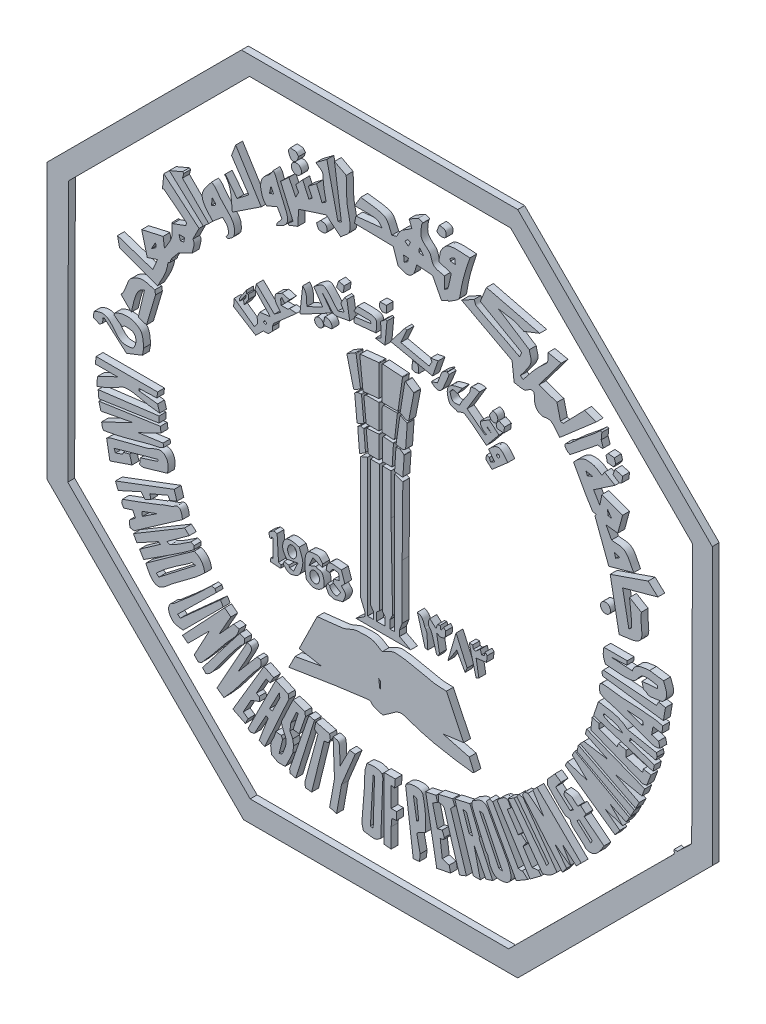
from build123d import *

# Parameters (mm, degrees)
BOSS_EXTRUDE2_DEPTH    = 10
BOSS_EXTRUDE2_2_DEPTH  = 10
BOSS_EXTRUDE2_3_DEPTH  = 10
BOSS_EXTRUDE2_4_DEPTH  = 10
BOSS_EXTRUDE2_5_DEPTH  = 10
BOSS_EXTRUDE2_6_DEPTH  = 10
BOSS_EXTRUDE2_7_DEPTH  = 10
BOSS_EXTRUDE2_8_DEPTH  = 10
BOSS_EXTRUDE2_9_DEPTH  = 10
BOSS_EXTRUDE2_10_DEPTH = 10
BOSS_EXTRUDE2_11_DEPTH = 10
BOSS_EXTRUDE2_12_DEPTH = 10
BOSS_EXTRUDE2_13_DEPTH = 10
BOSS_EXTRUDE3_DEPTH    = 10
BOSS_EXTRUDE3_2_DEPTH  = 10
BOSS_EXTRUDE3_3_DEPTH  = 10
BOSS_EXTRUDE3_4_DEPTH  = 10
BOSS_EXTRUDE3_5_DEPTH  = 10
BOSS_EXTRUDE3_6_DEPTH  = 10
SKETCH4_RX             = 8.030573163
SKETCH4_RY             = 7.001991294
BOSS_EXTRUDE3_7_DEPTH  = 10
SKETCH4_RX_2           = 8.376312739
SKETCH4_RY_2           = 6.574302061
BOSS_EXTRUDE3_8_DEPTH  = 10
BOSS_EXTRUDE3_9_DEPTH  = 10
SKETCH6_R              = 7.245742577
BOSS_EXTRUDE4_DEPTH    = 10
SKETCH6_R_2            = 7.326057841
BOSS_EXTRUDE4_2_DEPTH  = 10
BOSS_EXTRUDE4_3_DEPTH  = 10
BOSS_EXTRUDE4_4_DEPTH  = 10
BOSS_EXTRUDE4_5_DEPTH  = 10
BOSS_EXTRUDE4_6_DEPTH  = 10
BOSS_EXTRUDE4_7_DEPTH  = 10
BOSS_EXTRUDE4_8_DEPTH  = 10
BOSS_EXTRUDE4_9_DEPTH  = 10
BOSS_EXTRUDE4_10_DEPTH = 10
BOSS_EXTRUDE4_11_DEPTH = 10
BOSS_EXTRUDE4_12_DEPTH = 10
BOSS_EXTRUDE4_13_DEPTH = 10
BOSS_EXTRUDE4_14_DEPTH = 10
BOSS_EXTRUDE4_15_DEPTH = 10
BOSS_EXTRUDE4_16_DEPTH = 10
BOSS_EXTRUDE4_17_DEPTH = 10
BOSS_EXTRUDE4_18_DEPTH = 10
BOSS_EXTRUDE4_19_DEPTH = 10
BOSS_EXTRUDE4_20_DEPTH = 10
BOSS_EXTRUDE6_DEPTH    = 10
BOSS_EXTRUDE6_2_DEPTH  = 10
BOSS_EXTRUDE6_3_DEPTH  = 10
BOSS_EXTRUDE6_4_DEPTH  = 10
BOSS_EXTRUDE6_5_DEPTH  = 10
BOSS_EXTRUDE6_6_DEPTH  = 10
BOSS_EXTRUDE6_7_DEPTH  = 10
BOSS_EXTRUDE6_8_DEPTH  = 10
BOSS_EXTRUDE6_9_DEPTH  = 10
BOSS_EXTRUDE6_10_DEPTH = 10
BOSS_EXTRUDE6_11_DEPTH = 10
BOSS_EXTRUDE6_12_DEPTH = 10
BOSS_EXTRUDE6_13_DEPTH = 10
BOSS_EXTRUDE6_14_DEPTH = 10
BOSS_EXTRUDE6_15_DEPTH = 10
BOSS_EXTRUDE6_16_DEPTH = 10
BOSS_EXTRUDE6_17_DEPTH = 10
BOSS_EXTRUDE6_18_DEPTH = 10
BOSS_EXTRUDE6_19_DEPTH = 10
BOSS_EXTRUDE6_20_DEPTH = 10
BOSS_EXTRUDE6_21_DEPTH = 10
BOSS_EXTRUDE6_22_DEPTH = 10
BOSS_EXTRUDE6_23_DEPTH = 10
BOSS_EXTRUDE6_24_DEPTH = 10
BOSS_EXTRUDE6_25_DEPTH = 10
BOSS_EXTRUDE6_26_DEPTH = 10
BOSS_EXTRUDE6_27_DEPTH = 10
BOSS_EXTRUDE6_28_DEPTH = 10
BOSS_EXTRUDE6_29_DEPTH = 10
BOSS_EXTRUDE6_30_DEPTH = 10
BOSS_EXTRUDE6_31_DEPTH = 10
BOSS_EXTRUDE6_32_DEPTH = 10
BOSS_EXTRUDE6_33_DEPTH = 10
BOSS_EXTRUDE6_34_DEPTH = 10
BOSS_EXTRUDE6_35_DEPTH = 10
BOSS_EXTRUDE6_36_DEPTH = 10
BOSS_EXTRUDE6_37_DEPTH = 10
SKETCH8_R              = 2.212858845
BOSS_EXTRUDE7_DEPTH    = 10
BOSS_EXTRUDE7_2_DEPTH  = 10
BOSS_EXTRUDE7_3_DEPTH  = 10
BOSS_EXTRUDE7_4_DEPTH  = 10
BOSS_EXTRUDE7_5_DEPTH  = 10
BOSS_EXTRUDE7_6_DEPTH  = 10
BOSS_EXTRUDE7_7_DEPTH  = 10
BOSS_EXTRUDE7_8_DEPTH  = 10
BOSS_EXTRUDE7_9_DEPTH  = 10
BOSS_EXTRUDE7_10_DEPTH = 10
BOSS_EXTRUDE7_11_DEPTH = 10
BOSS_EXTRUDE7_12_DEPTH = 10
BOSS_EXTRUDE7_13_DEPTH = 10
BOSS_EXTRUDE7_14_DEPTH = 10
BOSS_EXTRUDE7_15_DEPTH = 10
BOSS_EXTRUDE7_16_DEPTH = 10
SKETCH8_R_2            = 6.324919709
BOSS_EXTRUDE7_17_DEPTH = 10
BOSS_EXTRUDE8_DEPTH    = 10


with BuildPart() as part:
    # Sketch3 → Boss-Extrude2 (new body)
    with BuildSketch(Plane.XY):
        with BuildLine():
            Line((523.849393143, 574.8342115), (523.849393143, 398.285257862))
            ThreePointArc((523.849393143, 398.285257862), (523.851278455, 398.266272657), (523.85686075, 398.248029018))
            Line((523.85686075, 398.248029018), (530.526851779, 382.290770798))
            ThreePointArc((530.526851779, 382.290770798), (530.532434074, 382.272527158), (530.534319386, 382.253541953))
            Line((530.534319386, 382.253541953), (530.534319386, 377.861688646))
            ThreePointArc((530.534319386, 377.861688646), (530.522884206, 377.816114553), (530.49128784, 377.781337679))
            Line((530.49128784, 377.781337679), (517.430116903, 369.084475859))
            ThreePointArc((517.430116903, 369.084475859), (517.391219577, 368.976176875), (517.483619094, 368.907591154))
            Line((517.483619094, 368.907591154), (546.829691955, 368.907591154))
            ThreePointArc((546.829691955, 368.907591154), (546.897951615, 368.935865231), (546.926225692, 369.004124891))
            Line((546.926225692, 369.004124891), (546.926225692, 368.811057417))
            ThreePointArc((546.926225692, 368.811057417), (546.954499769, 368.879317077), (547.022759429, 368.907591154))
            Line((547.022759429, 368.907591154), (596.212879663, 368.907591154))
            Line((596.212879663, 368.907591154), (580.149808672, 377.512807758))
            ThreePointArc((580.149808672, 377.512807758), (580.112571022, 377.548310782), (580.098860233, 377.597900313))
            Line((580.098860233, 377.597900313), (580.098860233, 385.653368522))
            ThreePointArc((580.098860233, 385.653368522), (580.100433082, 385.670723411), (580.105100376, 385.687512764))
            Line((580.105100376, 385.687512764), (583.995791748, 395.976348967))
            ThreePointArc((583.995791748, 395.976348967), (584.000459042, 395.99313832), (584.002031891, 396.010493209))
            Line((584.002031891, 396.010493209), (584.002031891, 475.205808644))
            Line((584.002031891, 475.205808644), (584.910191681, 573.764531295))
            ThreePointArc((584.910191681, 573.764531295), (584.89265306, 573.82091113), (584.845562711, 573.856531183))
            Line((584.845562711, 573.856531183), (573.1435371, 577.953784039))
            ThreePointArc((573.1435371, 577.953784039), (573.05578273, 577.941408146), (573.015102693, 577.862673614))
            Line((573.015102693, 577.862673614), (573.015102693, 380.137981651))
            ThreePointArc((573.015102693, 380.137981651), (572.986828616, 380.069721991), (572.918568956, 380.041447914))
            Line((572.918568956, 380.041447914), (566.388502095, 380.041447914))
            ThreePointArc((566.388502095, 380.041447914), (566.320242435, 380.069721991), (566.291968358, 380.137981651))
            Line((566.291968358, 380.137981651), (566.291968358, 391.872511728))
            ThreePointArc((566.291968358, 391.872511728), (566.294872332, 391.896011303), (566.303409539, 391.918097026))
            Line((566.303409539, 391.918097026), (570.069358933, 398.947869227))
            ThreePointArc((570.069358933, 398.947869227), (570.077786882, 398.969523842), (570.080796017, 398.992565062))
            Line((570.080796017, 398.992565062), (567.851367034, 519.875387389))
            Line((567.851367034, 519.875387389), (567.851367034, 578.967028578))
            ThreePointArc((567.851367034, 578.967028578), (567.823092957, 579.035288238), (567.754833297, 579.063562315))
            Line((567.754833297, 579.063562315), (555.428214979, 579.063562315))
            ThreePointArc((555.428214979, 579.063562315), (555.359955319, 579.035288238), (555.331681242, 578.967028578))
            Line((555.331681242, 578.967028578), (555.331681242, 396.647776293))
            ThreePointArc((555.331681242, 396.647776293), (555.337357001, 396.615163561), (555.353716859, 396.5863858))
            Line((555.353716859, 396.5863858), (559.19620365, 391.923480648))
            ThreePointArc((559.19620365, 391.923480648), (559.212563508, 391.894702887), (559.218239267, 391.862090155))
            Line((559.218239267, 391.862090155), (559.218239267, 380.137981651))
            ThreePointArc((559.218239267, 380.137981651), (559.18996519, 380.069721991), (559.12170553, 380.041447914))
            Line((559.12170553, 380.041447914), (547.110446852, 380.041447914))
            ThreePointArc((547.110446852, 380.041447914), (547.042187191, 380.069721991), (547.013913114, 380.137981651))
            Line((547.013913114, 380.137981651), (547.013913114, 391.851201974))
            ThreePointArc((547.013913114, 391.851201974), (547.023139876, 391.892387583), (547.049056359, 391.925700094))
            Line((547.049056359, 391.925700094), (551.270993063, 395.404804963))
            ThreePointArc((551.270993063, 395.404804963), (551.296909547, 395.438117474), (551.306136309, 395.479303083))
            Line((551.306136309, 395.479303083), (551.306136309, 578.967028578))
            ThreePointArc((551.306136309, 578.967028578), (551.277862231, 579.035288238), (551.209602571, 579.063562315))
            Line((551.209602571, 579.063562315), (538.134440906, 579.063562315))
            ThreePointArc((538.134440906, 579.063562315), (538.066181246, 579.035288238), (538.037907169, 578.967028578))
            Line((538.037907169, 578.967028578), (538.037907169, 396.642324785))
            ThreePointArc((538.037907169, 396.642324785), (538.042041389, 396.614376768), (538.054089939, 396.588822594))
            Line((538.054089939, 396.588822594), (542.245734029, 390.293703608))
            ThreePointArc((542.245734029, 390.293703608), (542.257782578, 390.268149433), (542.261916798, 390.240201417))
            Line((542.261916798, 390.240201417), (542.261916798, 380.137981651))
            ThreePointArc((542.261916798, 380.137981651), (542.233642721, 380.069721991), (542.165383061, 380.041447914))
            Line((542.165383061, 380.041447914), (533.910431277, 380.041447914))
            ThreePointArc((533.910431277, 380.041447914), (533.842171617, 380.069721991), (533.813897539, 380.137981651))
            Line((533.813897539, 380.137981651), (533.813897539, 578.918584623))
            ThreePointArc((533.813897539, 578.918584623), (533.770865778, 578.998935734), (533.680134957, 579.007650754))
            Line((533.680134957, 579.007650754), (523.908698036, 574.92327763))
            ThreePointArc((523.908698036, 574.92327763), (523.86557577, 574.887713476), (523.849393143, 574.8342115))
        make_face()
    extrude(amount=BOSS_EXTRUDE2_DEPTH)


with BuildPart() as body_2:
    # Sketch3 → Boss-Extrude2 2 (new body)
    with BuildSketch(Plane.XY):
        with BuildLine():
            Line((593.447076739, 654.642495327), (600.840307578, 692.740041968))
            ThreePointArc((600.840307578, 692.740041968), (600.800915848, 693.124267265), (600.555104047, 693.422188976))
            Line((600.555104047, 693.422188976), (588.862494752, 701.20202617))
            ThreePointArc((588.862494752, 701.20202617), (588.225928721, 701.25779362), (587.834777235, 700.752494861))
            Line((587.834777235, 700.752494861), (581.129292597, 658.943869477))
            ThreePointArc((581.129292597, 658.943869477), (581.187854508, 658.547023302), (581.46351083, 658.255595821))
            Line((581.46351083, 658.255595821), (588.777594746, 654.186837371))
            ThreePointArc((588.777594746, 654.186837371), (588.934300243, 654.124111757), (589.101735771, 654.102746831))
            Line((589.101735771, 654.102746831), (592.79251495, 654.102746831))
            ThreePointArc((592.79251495, 654.102746831), (593.21671407, 654.255086769), (593.447076739, 654.642495327))
        make_face()
    extrude(amount=BOSS_EXTRUDE2_2_DEPTH)


with BuildPart() as body_3:
    # Sketch3 → Boss-Extrude2 3 (new body)
    with BuildSketch(Plane.XY):
        with BuildLine():
            Line((555.638812208, 658.482667235), (577.263476464, 658.482667235))
            ThreePointArc((577.263476464, 658.482667235), (577.700091024, 658.645501749), (577.923451876, 659.054472754))
            Line((577.923451876, 659.054472754), (584.425201746, 704.238253132))
            ThreePointArc((584.425201746, 704.238253132), (584.284518269, 704.751457833), (583.8130816, 704.998274308))
            Line((583.8130816, 704.998274308), (555.686667473, 707.022166915))
            ThreePointArc((555.686667473, 707.022166915), (555.184566798, 706.845219366), (554.972039091, 706.357113336))
            Line((554.972039091, 706.357113336), (554.972039091, 659.149440351))
            ThreePointArc((554.972039091, 659.149440351), (555.167332415, 658.677960559), (555.638812208, 658.482667235))
        make_face()
    extrude(amount=BOSS_EXTRUDE2_3_DEPTH)


with BuildPart() as body_4:
    # Sketch3 → Boss-Extrude2 4 (new body)
    with BuildSketch(Plane.XY):
        with BuildLine():
            ThreePointArc((550.729898616, 705.269105306), (550.509081517, 705.764796359), (549.992887439, 705.932168655))
            Line((549.992887439, 705.932168655), (523.228644547, 703.097042102))
            ThreePointArc((523.228644547, 703.097042102), (522.780360208, 702.853169535), (522.635819259, 702.363740693))
            Line((522.635819259, 702.363740693), (527.213887412, 659.145730583))
            ThreePointArc((527.213887412, 659.145730583), (527.457759979, 658.697446245), (527.94718882, 658.552905295))
            Line((527.94718882, 658.552905295), (550.13336356, 660.903078747))
            ThreePointArc((550.13336356, 660.903078747), (550.558816552, 661.120186078), (550.729898616, 661.566142095))
            Line((550.729898616, 661.566142095), (550.729898616, 705.269105306))
        make_face()
    extrude(amount=BOSS_EXTRUDE2_4_DEPTH)


with BuildPart() as body_5:
    # Sketch3 → Boss-Extrude2 5 (new body)
    with BuildSketch(Plane.XY):
        with BuildLine():
            ThreePointArc((517.205107862, 700.818011937), (516.832753461, 701.315085468), (516.212204882, 701.289603013))
            Line((516.212204882, 701.289603013), (504.224276814, 694.337948341))
            ThreePointArc((504.224276814, 694.337948341), (503.94442639, 694.020331603), (503.912191797, 693.598244429))
            Line((503.912191797, 693.598244429), (513.706517466, 654.722563465))
            ThreePointArc((513.706517466, 654.722563465), (514.09389538, 654.271125597), (514.687569998, 654.308652181))
            Line((514.687569998, 654.308652181), (523.397349435, 659.359348062))
            ThreePointArc((523.397349435, 659.359348062), (523.665155729, 659.650090839), (523.721284899, 660.041372182))
            Line((523.721284899, 660.041372182), (517.205107862, 700.818011937))
        make_face()
    extrude(amount=BOSS_EXTRUDE2_5_DEPTH)


with BuildPart() as body_6:
    # Sketch3 → Boss-Extrude2 6 (new body)
    with BuildSketch(Plane.XY):
        with BuildLine():
            Line((585.192326498, 614.33103934), (588.622826888, 616.320345076))
            ThreePointArc((588.622826888, 616.320345076), (588.854105613, 616.544308229), (588.953484417, 616.850532324))
            Line((588.953484417, 616.850532324), (591.290657617, 650.195421102))
            ThreePointArc((591.290657617, 650.195421102), (591.19592342, 650.587327043), (590.892617534, 650.852977893))
            Line((590.892617534, 650.852977893), (581.576372577, 654.926037023))
            ThreePointArc((581.576372577, 654.926037023), (580.985012991, 654.897717858), (580.64929596, 654.410068179))
            Line((580.64929596, 654.410068179), (575.165781233, 616.302492519))
            ThreePointArc((575.165781233, 616.302492519), (575.291931324, 615.808004065), (575.730789048, 615.54754951))
            Line((575.730789048, 615.54754951), (584.762875143, 614.247871526))
            ThreePointArc((584.762875143, 614.247871526), (584.984615052, 614.253236237), (585.192326498, 614.33103934))
        make_face()
    extrude(amount=BOSS_EXTRUDE2_6_DEPTH)


with BuildPart() as body_7:
    # Sketch3 → Boss-Extrude2 7 (new body)
    with BuildSketch(Plane.XY):
        with BuildLine():
            ThreePointArc((555.019850564, 651.641328002), (554.98410106, 651.519643302), (554.972039091, 651.393390768))
            Line((554.972039091, 651.393390768), (554.972039091, 621.586266581))
            ThreePointArc((554.972039091, 621.586266581), (555.167332415, 621.114786789), (555.638812208, 620.919493464))
            Line((555.638812208, 620.919493464), (559.025171793, 620.919493464))
            Line((559.025171793, 620.919493464), (569.650362702, 620.174764292))
            ThreePointArc((569.650362702, 620.174764292), (569.749029198, 620.175166843), (569.846556025, 620.190125374))
            Line((569.846556025, 620.190125374), (572.556247059, 620.813869438))
            ThreePointArc((572.556247059, 620.813869438), (572.903673218, 621.019151891), (573.069055495, 621.387247698))
            Line((573.069055495, 621.387247698), (576.973991766, 655.241846518))
            ThreePointArc((576.973991766, 655.241846518), (576.809369913, 655.761894507), (576.311610357, 655.985021579))
            Line((576.311610357, 655.985021579), (557.21099099, 655.985021579))
            ThreePointArc((557.21099099, 655.985021579), (556.837314321, 655.870473178), (556.592029347, 655.566185697))
            Line((556.592029347, 655.566185697), (555.019850564, 651.641328002))
        make_face()
    extrude(amount=BOSS_EXTRUDE2_7_DEPTH)


with BuildPart() as body_8:
    # Sketch3 → Boss-Extrude2 8 (new body)
    with BuildSketch(Plane.XY):
        with BuildLine():
            Line((550.729898616, 620.834581403), (550.729898616, 655.318248463))
            ThreePointArc((550.729898616, 655.318248463), (550.534605292, 655.789728255), (550.0631255, 655.985021579))
            Line((550.0631255, 655.985021579), (532.003234804, 655.985021579))
            ThreePointArc((532.003234804, 655.985021579), (531.814533564, 655.957762521), (531.641261315, 655.87821416))
            Line((531.641261315, 655.87821416), (528.867907743, 654.085460648))
            ThreePointArc((528.867907743, 654.085460648), (528.629476004, 653.815494867), (528.566243738, 653.460906517))
            Line((528.566243738, 653.460906517), (531.747882694, 620.769992969))
            ThreePointArc((531.747882694, 620.769992969), (531.963457381, 620.340793888), (532.411520188, 620.167808286))
            Line((532.411520188, 620.167808286), (550.0631255, 620.167808286))
            ThreePointArc((550.0631255, 620.167808286), (550.534605292, 620.36310161), (550.729898616, 620.834581403))
        make_face()
    extrude(amount=BOSS_EXTRUDE2_8_DEPTH)


with BuildPart() as body_9:
    # Sketch3 → Boss-Extrude2 9 (new body)
    with BuildSketch(Plane.XY):
        with BuildLine():
            Line((528.480808185, 619.176422931), (525.169332013, 653.201396461))
            ThreePointArc((525.169332013, 653.201396461), (524.929286172, 653.651741518), (524.441106086, 653.800445521))
            Line((524.441106086, 653.800445521), (519.68956649, 653.338002541))
            ThreePointArc((519.68956649, 653.338002541), (519.534665223, 653.303976562), (519.392181435, 653.234330744))
            Line((519.392181435, 653.234330744), (515.498055258, 650.717086477))
            ThreePointArc((515.498055258, 650.717086477), (515.259623519, 650.447120696), (515.196391253, 650.092532346))
            Line((515.196391253, 650.092532346), (518.597693621, 615.144606706))
            ThreePointArc((518.597693621, 615.144606706), (518.928339225, 614.631525), (519.538043985, 614.602551606))
            Line((519.538043985, 614.602551606), (528.093883562, 618.505190965))
            ThreePointArc((528.093883562, 618.505190965), (528.394840831, 618.778842608), (528.480808185, 619.176422931))
        make_face()
    extrude(amount=BOSS_EXTRUDE2_9_DEPTH)


with BuildPart() as body_10:
    # Sketch3 → Boss-Extrude2 10 (new body)
    with BuildSketch(Plane.XY):
        with BuildLine():
            Line((580.83801004, 612.770843998), (575.663374498, 612.770843998))
            ThreePointArc((575.663374498, 612.770843998), (575.207004649, 612.590191184), (574.997928804, 612.146123431))
            Line((574.997928804, 612.146123431), (573.055034402, 581.40147842))
            ThreePointArc((573.055034402, 581.40147842), (573.208971269, 580.93170504), (573.644078152, 580.69704446))
            Line((573.644078152, 580.69704446), (584.218045719, 579.477397177))
            ThreePointArc((584.218045719, 579.477397177), (584.720410015, 579.62680445), (584.959588951, 580.093158236))
            Line((584.959588951, 580.093158236), (586.922949066, 608.104785558))
            ThreePointArc((586.922949066, 608.104785558), (586.862386223, 608.432602091), (586.650699249, 608.690129104))
            Line((586.650699249, 608.690129104), (581.230901511, 612.642794076))
            ThreePointArc((581.230901511, 612.642794076), (581.044625922, 612.738023771), (580.83801004, 612.770843998))
        make_face()
    extrude(amount=BOSS_EXTRUDE2_10_DEPTH)


with BuildPart() as body_11:
    # Sketch3 → Boss-Extrude2 11 (new body)
    with BuildSketch(Plane.XY):
        with BuildLine():
            Line((569.468753044, 585.075221633), (571.340629147, 614.696062712))
            ThreePointArc((571.340629147, 614.696062712), (571.177180549, 615.176960684), (570.722440174, 615.403211639))
            Line((570.722440174, 615.403211639), (556.579950522, 616.408070038))
            ThreePointArc((556.579950522, 616.408070038), (556.078228799, 616.230875238), (555.865920685, 615.74297366))
            Line((555.865920685, 615.74297366), (555.865920685, 585.117274182))
            ThreePointArc((555.865920685, 585.117274182), (556.06121401, 584.64579439), (556.532693802, 584.450501066))
            Line((556.532693802, 584.450501066), (568.803307349, 584.450501066))
            ThreePointArc((568.803307349, 584.450501066), (569.259677199, 584.631153879), (569.468753044, 585.075221633))
        make_face()
    extrude(amount=BOSS_EXTRUDE2_11_DEPTH)


with BuildPart() as body_12:
    # Sketch3 → Boss-Extrude2 12 (new body)
    with BuildSketch(Plane.XY):
        with BuildLine():
            Line((550.729898616, 584.437100877), (550.729898616, 615.734633868))
            ThreePointArc((550.729898616, 615.734633868), (550.514765541, 616.225151616), (550.008190869, 616.399140132))
            Line((550.008190869, 616.399140132), (532.480727354, 614.950147434))
            ThreePointArc((532.480727354, 614.950147434), (532.02382095, 614.712964402), (531.87202449, 614.221052736))
            Line((531.87202449, 614.221052736), (534.777029835, 584.372512443))
            ThreePointArc((534.777029835, 584.372512443), (534.992604522, 583.943313362), (535.440667329, 583.77032776))
            Line((535.440667329, 583.77032776), (550.0631255, 583.77032776))
            ThreePointArc((550.0631255, 583.77032776), (550.534605292, 583.965621085), (550.729898616, 584.437100877))
        make_face()
    extrude(amount=BOSS_EXTRUDE2_12_DEPTH)


with BuildPart() as body_13:
    # Sketch3 → Boss-Extrude2 13 (new body)
    with BuildSketch(Plane.XY):
        with BuildLine():
            Line((530.877389259, 583.828452467), (528.568603342, 611.756240491))
            ThreePointArc((528.568603342, 611.756240491), (528.400215695, 612.146786172), (528.02998179, 612.356087831))
            Line((528.02998179, 612.356087831), (523.870513672, 613.155763861))
            ThreePointArc((523.870513672, 613.155763861), (523.617420434, 613.155507964), (523.38265547, 613.060947588))
            Line((523.38265547, 613.060947588), (519.944792302, 610.838641233))
            ThreePointArc((519.944792302, 610.838641233), (519.708484274, 610.573031807), (519.642259527, 610.223740906))
            Line((519.642259527, 610.223740906), (522.224804903, 578.984473844))
            ThreePointArc((522.224804903, 578.984473844), (522.594954896, 578.441126956), (523.251284657, 578.479442777))
            Line((523.251284657, 578.479442777), (530.574856484, 583.21355214))
            ThreePointArc((530.574856484, 583.21355214), (530.811164513, 583.479161565), (530.877389259, 583.828452467))
        make_face()
    extrude(amount=BOSS_EXTRUDE2_13_DEPTH)


with BuildPart() as body_14:
    # Sketch4 → Boss-Extrude3 (new body)
    with BuildSketch(Plane.XY):
        with BuildLine():
            Line((648, 343), (673, 291))
            Line((673, 291), (643, 287))
            Line((643, 287), (681, 277))
            Line((681, 277), (688, 261))
            add(Edge.make_bspline(
                [(688, 261), (687.333333333, 260.666666667), (686.740416468, 259.914331979), (686, 260), (560.985768874, 274.464456494), (599.505629888, 298.6404581), (556, 267)],
                knots=[0, 0, 0, 0, 1, 1, 1, 2, 2, 2, 2], degree=3))
            add(Edge.make_bspline(
                [(556, 267), (551.666666667, 268.333333333), (547.134491153, 269.139478981), (543, 271), (540.385118198, 272.176696811), (538.853892044, 276.278428492), (536, 276), (497.104975183, 272.205363432), (458.666666667, 264.666666667), (420, 259)],
                knots=[0, 0, 0, 0, 1, 1, 1, 2, 2, 2, 3, 3, 3, 3], degree=3))
            Line((420, 259), (429, 277))
            Line((429, 277), (467, 284))
            Line((467, 284), (435, 290))
            Line((435, 290), (461, 343))
            add(Edge.make_bspline(
                [(461, 343), (473, 344.333333333), (485.029332676, 345.424912194), (497, 347), (504.629833284, 348.003925432), (511.319388985, 353.519961812), (519, 354), (542.446134373, 355.465383398), (541.613142031, 354.366786231), (555, 346)],
                knots=[0, 0, 0, 0, 1, 1, 1, 2, 2, 2, 3, 3, 3, 3], degree=3))
            add(Edge.make_bspline(
                [(555, 346), (561.666666667, 348.666666667), (567.822265192, 354.188887758), (575, 354), (593.95538784, 353.501174004), (612.249726336, 346.825383703), (631, 344), (636.613094491, 343.154191241), (642.333333333, 343.333333333), (648, 343)],
                knots=[0, 0, 0, 0, 1, 1, 1, 2, 2, 2, 3, 3, 3, 3], degree=3))
        make_face()
        Polygon((550, 310), (553, 307), (552, 295), align=None, mode=Mode.SUBTRACT)
    extrude(amount=BOSS_EXTRUDE3_DEPTH)


with BuildPart() as body_15:
    # Sketch4 → Boss-Extrude3 2 (new body)
    with BuildSketch(Plane.XY):
        Polygon((681, 420), (686, 420), (687, 415), (690, 414), (697, 420), (699, 414), (703, 415), (704, 420), (707, 417), (706, 408), (691, 406), (695, 383), (691, 381), align=None)
    extrude(amount=BOSS_EXTRUDE3_2_DEPTH)


with BuildPart() as body_16:
    # Sketch4 → Boss-Extrude3 3 (new body)
    with BuildSketch(Plane.XY):
        Polygon((662, 423), (678, 387), (675, 380), (663, 402), (650, 382), align=None)
    extrude(amount=BOSS_EXTRUDE3_3_DEPTH)


with BuildPart() as body_17:
    # Sketch4 → Boss-Extrude3 4 (new body)
    with BuildSketch(Plane.XY):
        with BuildLine():
            Line((624, 422), (633, 414))
            Line((633, 414), (635, 420))
            Line((635, 420), (639, 421))
            Line((639, 421), (640, 415))
            Line((640, 415), (644, 421))
            Line((644, 421), (647, 418))
            add(Edge.make_bspline(
                [(647, 418), (646.492513914, 413.940111309), (647.716286109, 408.143257222), (642, 407), (637.510423226, 406.102084645), (636.974446503, 407.025553497), (635, 409)],
                knots=[0, 0, 0, 0, 1, 1, 1, 2, 2, 2, 2], degree=3))
            Line((635, 409), (634, 408))
            Line((634, 408), (638, 385))
            Line((638, 385), (636, 381))
            add(Edge.make_bspline(
                [(636, 381), (635.333333333, 381.333333333), (634.308430504, 381.321452891), (634, 382), (632.559923476, 385.168168353), (632.013272171, 388.670677153), (631, 392), (629.679924623, 396.337390524), (628.524889862, 400.730308388), (627, 405), (625.24046389, 409.926701109), (621.437468702, 410.812155718), (622, 417), (622.162516638, 418.787683016), (623.333333333, 420.333333333), (624, 422)],
                knots=[0, 0, 0, 0, 1, 1, 1, 2, 2, 2, 3, 3, 3, 4, 4, 4, 5, 5, 5, 5], degree=3))
        make_face()
    extrude(amount=BOSS_EXTRUDE3_4_DEPTH)


with BuildPart() as body_18:
    # Sketch4 → Boss-Extrude3 5 (new body)
    with BuildSketch(Plane.XY):
        with BuildLine():
            Line((621, 381), (617, 382))
            Line((617, 382), (606, 421))
            add(Edge.make_bspline(
                [(606, 421), (613.966869303, 419.008282674), (614.421964534, 413.874761242), (617, 407), (617.165521178, 406.558610193), (617.814304662, 406.433289122), (618, 406), (618.830454799, 404.062272137), (619.74881982, 402.093168164), (620, 400), (620.755630808, 393.7030766), (620.666666667, 387.333333333), (621, 381)],
                knots=[0, 0, 0, 0, 1, 1, 1, 2, 2, 2, 3, 3, 3, 4, 4, 4, 4], degree=3))
        make_face()
    extrude(amount=BOSS_EXTRUDE3_5_DEPTH)


with BuildPart() as body_19:
    # Sketch4 → Boss-Extrude3 6 (new body)
    with BuildSketch(Plane.XY):
        with BuildLine():
            Line((496, 419), (501, 404))
            Line((501, 404), (496, 399))
            add(Edge.make_bspline(
                [(496, 399), (498.252370025, 396.184537468), (502.509901951, 393.56931366), (502, 390), (501.492281793, 386.445972551), (499.333333333, 383.333333333), (498, 380)],
                knots=[0, 0, 0, 0, 1, 1, 1, 2, 2, 2, 2], degree=3))
            Line((498, 380), (486, 377))
            Line((486, 377), (478, 379))
            add(Edge.make_bspline(
                [(478, 379), (473.197227028, 388.605545944), (472.892726935, 384.231817338), (476, 392)],
                knots=[0, 0, 0, 0, 1, 1, 1, 1], degree=3))
            Line((476, 392), (479, 391))
            ThreePointArc((479, 391), (482.970075806, 384.896354233), (490, 383))
            Line((490, 383), (495, 390))
            Line((495, 390), (484, 397))
            Line((484, 397), (485, 402))
            Line((485, 402), (493, 404))
            Line((493, 404), (492, 413))
            add(Edge.make_bspline(
                [(492, 413), (483.607449655, 414.398758391), (482.915322751, 414.830645502), (479, 407)],
                knots=[0, 0, 0, 0, 1, 1, 1, 1], degree=3))
            Line((479, 407), (474, 408))
            add(Edge.make_bspline(
                [(474, 408), (474.618381539, 412.328670772), (475.403321351, 420), (482, 420), (486.678556283, 420), (491.333333333, 419.333333333), (496, 419)],
                knots=[0, 0, 0, 0, 1, 1, 1, 2, 2, 2, 2], degree=3))
        make_face()
    extrude(amount=BOSS_EXTRUDE3_6_DEPTH)


with BuildPart() as body_20:
    # Sketch4 → Boss-Extrude3 7 (new body)
    with BuildSketch(Plane.XY):
        with BuildLine():
            Line((469, 413), (468, 408))
            Line((468, 408), (455, 414))
            Line((455, 414), (449, 401))
            Line((449, 401), (459, 405))
            add(Edge.make_bspline(
                [(459, 405), (462.9497014, 401.0502986), (466.291043705, 405.501495109), (469, 399), (470.431219508, 395.565073182), (472.366651453, 387.845808612), (470, 384), (466.211368738, 377.843474199), (456.033553378, 374.173157297), (450, 379), (448.333333333, 380.333333333), (445.418585326, 380.90707337), (445, 383), (443.888385336, 388.558073318), (439.300409832, 417.152696289), (451, 419), (464.501805158, 421.131863972), (463.275842592, 420.15519676), (469, 413)],
                knots=[0, 0, 0, 0, 1, 1, 1, 2, 2, 2, 3, 3, 3, 4, 4, 4, 5, 5, 5, 6, 6, 6, 6], degree=3))
        make_face()
        with Locations(Location((457.340935215, 390.908666461), (0, 0, -90.726586628))):
            Ellipse(SKETCH4_RX, SKETCH4_RY, mode=Mode.SUBTRACT)
    extrude(amount=BOSS_EXTRUDE3_7_DEPTH)


with BuildPart() as body_21:
    # Sketch4 → Boss-Extrude3 8 (new body)
    with BuildSketch(Plane.XY):
        with BuildLine():
            Line((412, 384), (413, 388))
            Line((413, 388), (420, 387))
            Line((420, 387), (421, 384))
            Line((421, 384), (427, 383))
            Line((427, 383), (433, 396))
            Line((433, 396), (417, 393))
            add(Edge.make_bspline(
                [(417, 393), (413.884093837, 397.15454155), (410.598021283, 401.372297964), (411, 407), (412.084478863, 422.182704089), (424.296507723, 420.567830759), (435, 417)],
                knots=[0, 0, 0, 0, 1, 1, 1, 2, 2, 2, 2], degree=3))
            add(Edge.make_bspline(
                [(435, 417), (436.925956726, 410.740640641), (440.971475826, 404.476505509), (440, 398), (439.145822499, 392.305483326), (437.328390602, 381.617282358), (430, 379), (419.485158191, 375.244699354), (418.575102925, 377.424897075), (412, 384)],
                knots=[0, 0, 0, 0, 1, 1, 1, 2, 2, 2, 3, 3, 3, 3], degree=3))
        make_face()
        with Locations(Location((424.746098036, 406.142869192), (0, 0, -95.367880936))):
            Ellipse(SKETCH4_RX_2, SKETCH4_RY_2, mode=Mode.SUBTRACT)
    extrude(amount=BOSS_EXTRUDE3_8_DEPTH)


with BuildPart() as body_22:
    # Sketch4 → Boss-Extrude3 9 (new body)
    with BuildSketch(Plane.XY):
        Polygon((398, 419), (403, 418), (405, 383), (409, 382), (408, 377), (393, 378), (394, 383), (397, 384), (397, 409), (395, 410), (394, 407), (392, 408), (391, 414), align=None)
    extrude(amount=BOSS_EXTRUDE3_9_DEPTH)


with BuildPart() as body_23:
    # Sketch6 → Boss-Extrude4 (new body)
    with BuildSketch(Plane.XY):
        with Locations((878.273587384, 562.465089689)):
            Circle(SKETCH6_R)
    extrude(amount=BOSS_EXTRUDE4_DEPTH)


with BuildPart() as body_24:
    # Sketch6 → Boss-Extrude4 2 (new body)
    with BuildSketch(Plane.XY):
        with Locations((430.88252258, 889.04677969)):
            Circle(SKETCH6_R_2)
    extrude(amount=BOSS_EXTRUDE4_2_DEPTH)


with BuildPart() as body_25:
    # Sketch6 → Boss-Extrude4 3 (new body)
    with BuildSketch(Plane.XY):
        with BuildLine():
            Line((940, 627), (954, 614))
            Line((954, 614), (903, 600))
            Line((903, 600), (912, 553))
            add(Edge.make_bspline(
                [(912, 553), (913.333333333, 554.333333333), (915.836649629, 555.121470732), (916, 557), (916.696724596, 565.012332852), (913.591444983, 584.128325248), (913, 593)],
                knots=[0, 0, 0, 0, 1, 1, 1, 2, 2, 2, 2], degree=3))
            Line((913, 593), (930, 583))
            add(Edge.make_bspline(
                [(930, 583), (929.646523045, 577.344368722), (929.667241876, 571.656888115), (930, 566), (930.313184117, 560.67587001), (931.75211, 555.037316249), (930, 550), (927.820330071, 543.733448953), (919.317812688, 541.886302115), (914, 541), (908.698291963, 540.116381994), (903.333333333, 539.666666667), (898, 539)],
                knots=[0, 0, 0, 0, 1, 1, 1, 2, 2, 2, 3, 3, 3, 4, 4, 4, 4], degree=3))
            Line((898, 539), (885, 608))
            Line((885, 608), (940, 627))
        make_face()
    extrude(amount=BOSS_EXTRUDE4_3_DEPTH)


with BuildPart() as body_26:
    # Sketch6 → Boss-Extrude4 4 (new body)
    with BuildSketch(Plane.XY):
        with BuildLine():
            Line((873, 726), (877, 732))
            Line((877, 732), (892, 723))
            Line((892, 723), (861, 702))
            Line((861, 702), (870, 687))
            Line((870, 687), (873, 702))
            Line((873, 702), (903, 691))
            Line((903, 691), (896, 665))
            Line((896, 665), (879, 667))
            Line((879, 667), (887, 652))
            add(Edge.make_bspline(
                [(887, 652), (893.333333333, 650.666666667), (900.89977811, 651.984548351), (906, 648), (912.487588769, 642.931571274), (914.666666667, 634), (919, 627)],
                knots=[0, 0, 0, 0, 1, 1, 1, 2, 2, 2, 2], degree=3))
            Line((919, 627), (883, 617))
            Line((883, 617), (863, 670))
            Line((863, 670), (865, 673))
            add(Edge.make_bspline(
                [(865, 673), (863, 673.666666667), (860.177633001, 673.251393423), (859, 675), (848.907334786, 689.986078651), (841, 706.333333333), (832, 722)],
                knots=[0, 0, 0, 0, 1, 1, 1, 2, 2, 2, 2], degree=3))
            add(Edge.make_bspline(
                [(832, 722), (834.333333333, 724.333333333), (836.254374108, 727.169582739), (839, 729), (842.351233986, 731.234155991), (845.974884229, 733.856245865), (850, 734), (861.877686006, 734.424203072), (865.237445892, 731.175036072), (873, 726)],
                knots=[0, 0, 0, 0, 1, 1, 1, 2, 2, 2, 3, 3, 3, 3], degree=3))
        make_face()
        Polygon((850, 720), (860, 718), (852, 715), align=None, mode=Mode.SUBTRACT)
        Polygon((881, 688), (887, 679), (882, 680), align=None, mode=Mode.SUBTRACT)
        Polygon((891, 639), (899, 636), (893, 632), align=None, mode=Mode.SUBTRACT)
    extrude(amount=BOSS_EXTRUDE4_4_DEPTH)


with BuildPart() as body_27:
    # Sketch6 → Boss-Extrude4 5 (new body)
    with BuildSketch(Plane.XY):
        Polygon((892, 743), (903, 740), (902, 731), (898, 729), (889, 735), align=None)
    extrude(amount=BOSS_EXTRUDE4_5_DEPTH)


with BuildPart() as body_28:
    # Sketch6 → Boss-Extrude4 6 (new body)
    with BuildSketch(Plane.XY):
        Polygon((882, 758), (891, 757), (893, 750), (890, 745), (881, 746), (879, 754), align=None)
    extrude(amount=BOSS_EXTRUDE4_6_DEPTH)


with BuildPart() as body_29:
    # Sketch6 → Boss-Extrude4 7 (new body)
    with BuildSketch(Plane.XY):
        with BuildLine():
            Line((871, 781), (873, 780))
            Line((873, 780), (872, 770))
            Line((872, 770), (875, 761))
            Line((875, 761), (874, 760))
            Line((874, 760), (867, 761))
            Line((867, 761), (827, 729))
            add(Edge.make_bspline(
                [(827, 729), (823.138272942, 730.287242353), (816.918096341, 735.918096341), (821, 740), (822.054092553, 741.054092553), (823.786957762, 741.133541258), (825, 742), (830.564000059, 745.974285757), (835.728930645, 751.607442204), (841, 756), (850.927856683, 764.273213903), (861.862653001, 771.862653001), (871, 781)],
                knots=[0, 0, 0, 0, 1, 1, 1, 2, 2, 2, 3, 3, 3, 4, 4, 4, 4], degree=3))
        make_face()
    extrude(amount=BOSS_EXTRUDE4_7_DEPTH)


with BuildPart() as body_30:
    # Sketch6 → Boss-Extrude4 8 (new body)
    with BuildSketch(Plane.XY):
        with BuildLine():
            Line((706, 878), (783, 859))
            Line((783, 859), (760, 850))
            add(Edge.make_bspline(
                [(760, 850), (755.333333333, 852), (750.901325711, 854.675317375), (746, 856), (738.487788224, 858.030327507), (730.666666667, 858.666666667), (723, 860)],
                knots=[0, 0, 0, 0, 1, 1, 1, 2, 2, 2, 2], degree=3))
            Line((723, 860), (768, 831))
            add(Edge.make_bspline(
                [(768, 831), (768.666666667, 825.666666667), (771.699673171, 820.099019514), (770, 815), (767.105560887, 806.316682662), (760, 799.666666667), (755, 792)],
                knots=[0, 0, 0, 0, 1, 1, 1, 2, 2, 2, 2], degree=3))
            Line((755, 792), (759, 789))
            add(Edge.make_bspline(
                [(759, 789), (795.8, 838.066666667), (795, 817), (795, 841)],
                knots=[0, 0, 0, 0, 1, 1, 1, 1], degree=3))
            Line((795, 841), (814, 837))
            Line((814, 837), (782, 794))
            Line((782, 794), (808, 785))
            Line((808, 785), (813, 764))
            Line((813, 764), (817, 763))
            Line((817, 763), (848, 795))
            Line((848, 795), (865, 789))
            Line((865, 789), (812, 743))
            add(Edge.make_bspline(
                [(812, 743), (807.666666667, 747.666666667), (804.613550394, 753.99274086), (799, 757), (794.582816786, 759.36634815), (788.520683709, 755.837933878), (784, 758), (773.945377867, 762.808732325), (775.65503957, 772.484485591), (775, 781)],
                knots=[0, 0, 0, 0, 1, 1, 1, 2, 2, 2, 3, 3, 3, 3], degree=3))
            add(Edge.make_bspline(
                [(775, 781), (773.333333333, 781.333333333), (771.634276457, 782.466936131), (770, 782), (766.700168354, 781.057190958), (764.405375339, 777.425671917), (761, 777), (755.99470366, 776.374337957), (751, 778.333333333), (746, 779)],
                knots=[0, 0, 0, 0, 1, 1, 1, 2, 2, 2, 3, 3, 3, 3], degree=3))
            Line((746, 779), (743, 805))
            Line((743, 805), (670, 844))
            Line((670, 844), (688, 854))
            add(Edge.make_bspline(
                [(688, 854), (689.333333333, 851.666666667), (689.688672568, 848.371126443), (692, 847), (712.002306615, 835.134224889), (733.807253566, 826.538712248), (754, 815)],
                knots=[0, 0, 0, 0, 1, 1, 1, 2, 2, 2, 2], degree=3))
            Line((754, 815), (757, 822))
            Line((757, 822), (697, 856))
            Line((697, 856), (706, 878))
        make_face()
    extrude(amount=BOSS_EXTRUDE4_8_DEPTH)


with BuildPart() as body_31:
    # Sketch6 → Boss-Extrude4 9 (new body)
    with BuildSketch(Plane.XY):
        with BuildLine():
            Line((634, 913), (638, 922))
            add(Edge.make_bspline(
                [(638, 922), (646.841736351, 920.736894807), (648.490775841, 919.944655045), (647, 911)],
                knots=[0, 0, 0, 0, 1, 1, 1, 1], degree=3))
            ThreePointArc((647, 911), (640.044253309, 909.037646508), (634, 913))
        make_face()
    extrude(amount=BOSS_EXTRUDE4_9_DEPTH)


with BuildPart() as body_32:
    # Sketch6 → Boss-Extrude4 10 (new body)
    with BuildSketch(Plane.XY):
        with BuildLine():
            Line((645, 862), (645, 845))
            add(Edge.make_bspline(
                [(645, 845), (646.666666667, 846.333333333), (649.20731312, 847.018282799), (650, 849), (652.672407613, 855.681019033), (653.333333333, 863), (655, 870)],
                knots=[0, 0, 0, 0, 1, 1, 1, 2, 2, 2, 2], degree=3))
            Line((655, 870), (637, 876))
            add(Edge.make_bspline(
                [(637, 876), (638.333333333, 881.666666667), (638.032228005, 887.991884758), (641, 893), (643.654455969, 897.479394448), (647.941455726, 901.766208714), (653, 903), (662.391363275, 905.290576409), (672.333333333, 903), (682, 903)],
                knots=[0, 0, 0, 0, 1, 1, 1, 2, 2, 2, 3, 3, 3, 3], degree=3))
            add(Edge.make_bspline(
                [(682, 903), (657.951008435, 835.035458621), (678.489617582, 850.181010989), (651, 833)],
                knots=[0, 0, 0, 0, 1, 1, 1, 1], degree=3))
            Line((651, 833), (650, 834))
            Line((650, 834), (641, 829))
            Line((641, 829), (628, 854))
            Line((628, 854), (605, 856))
            add(Edge.make_bspline(
                [(605, 856), (603.333333333, 851.333333333), (603.070558198, 845.889373717), (600, 842), (592.827481163, 832.914809474), (586.069937472, 838.310020843), (578, 841)],
                knots=[0, 0, 0, 0, 1, 1, 1, 2, 2, 2, 2], degree=3))
            Line((578, 841), (571, 862))
            Line((571, 862), (515, 863))
            Line((515, 863), (517, 873))
            Line((517, 873), (555, 877))
            add(Edge.make_bspline(
                [(555, 877), (552.333333333, 879.333333333), (550.474571855, 883.305085629), (547, 884), (536.535366848, 886.09292663), (525.666666667, 884.666666667), (515, 885)],
                knots=[0, 0, 0, 0, 1, 1, 1, 2, 2, 2, 2], degree=3))
            Line((515, 885), (524, 900))
            add(Edge.make_bspline(
                [(524, 900), (535, 898), (546.672249202, 898.282238136), (557, 894), (563.919507398, 891.130935957), (565.65004146, 881.699917081), (569, 875)],
                knots=[0, 0, 0, 0, 1, 1, 1, 2, 2, 2, 2], degree=3))
            Line((569, 875), (576, 877))
            add(Edge.make_bspline(
                [(576, 877), (582.554667073, 891.748000915), (586.261121324, 888.608897059), (598, 898)],
                knots=[0, 0, 0, 0, 1, 1, 1, 1], degree=3))
            Line((598, 898), (594, 908))
            add(Edge.make_bspline(
                [(594, 908), (610.626648518, 915.759102642), (603.876992023, 917.049203191), (614, 913)],
                knots=[0, 0, 0, 0, 1, 1, 1, 1], degree=3))
            add(Edge.make_bspline(
                [(614, 913), (613.333333333, 911.666666667), (612.148331386, 910.483313865), (612, 909), (611.469313499, 903.693134986), (609.960790439, 897.928089773), (612, 893), (614.254831249, 887.550824483), (620.643215825, 884.848688253), (624, 880), (626.716615541, 876.075999773), (626.376366609, 870.105971478), (630, 867), (634.001633653, 863.570028297), (640, 863.666666667), (645, 862)],
                knots=[0, 0, 0, 0, 1, 1, 1, 2, 2, 2, 3, 3, 3, 4, 4, 4, 5, 5, 5, 5], degree=3))
        make_face()
        Polygon((660, 892), (661, 884), (654, 885), (653, 888), align=None, mode=Mode.SUBTRACT)
        Polygon((592, 881), (596, 880), (593, 873), (588, 877), align=None, mode=Mode.SUBTRACT)
        Polygon((609, 880), (615, 872), (608, 873), align=None, mode=Mode.SUBTRACT)
        Polygon((586, 859), (593, 858), (592, 853), (587, 850), align=None, mode=Mode.SUBTRACT)
    extrude(amount=BOSS_EXTRUDE4_10_DEPTH)


with BuildPart() as body_33:
    # Sketch6 → Boss-Extrude4 11 (new body)
    with BuildSketch(Plane.XY):
        with BuildLine():
            Line((486, 926), (503, 917))
            add(Edge.make_bspline(
                [(503, 917), (503.333333333, 906.333333333), (503.373325997, 895.653458057), (504, 885), (504.6895498, 873.277653394), (510.443726901, 861.485516433), (508, 850), (506.674703012, 843.771104155), (499.333333333, 840.666666667), (495, 836)],
                knots=[0, 0, 0, 0, 1, 1, 1, 2, 2, 2, 3, 3, 3, 3], degree=3))
            Line((495, 836), (474, 853))
            Line((474, 853), (434, 840))
            Line((434, 840), (433, 818))
            Line((433, 818), (420, 813))
            Line((420, 813), (419, 815))
            Line((419, 815), (426, 821))
            Line((426, 821), (408, 862))
            Line((408, 862), (420, 873))
            Line((420, 873), (430, 853))
            Line((430, 853), (434, 861))
            Line((434, 861), (430, 869))
            Line((430, 869), (440, 880))
            Line((440, 880), (449, 860))
            Line((449, 860), (454, 864))
            Line((454, 864), (448, 876))
            Line((448, 876), (460, 885))
            Line((460, 885), (468, 865))
            Line((468, 865), (474, 869))
            add(Edge.make_bspline(
                [(474, 869), (464.446027757, 909.338993914), (475.830867569, 899.77942162), (459, 911)],
                knots=[0, 0, 0, 0, 1, 1, 1, 1], degree=3))
            Line((459, 911), (475, 923))
            Line((475, 923), (491, 853))
            Line((491, 853), (496, 855))
            Line((496, 855), (486, 926))
        make_face()
    extrude(amount=BOSS_EXTRUDE4_11_DEPTH)


with BuildPart() as body_34:
    # Sketch6 → Boss-Extrude4 12 (new body)
    with BuildSketch(Plane.XY):
        with BuildLine():
            Line((463, 829), (460, 836))
            Line((460, 836), (466, 842))
            add(Edge.make_bspline(
                [(466, 842), (469.752525549, 841.374579075), (473.982211464, 842.08894268), (475, 837), (476.877120786, 827.61439607), (468.769185703, 828.175830614), (463, 829)],
                knots=[0, 0, 0, 0, 1, 1, 1, 2, 2, 2, 2], degree=3))
        make_face()
    extrude(amount=BOSS_EXTRUDE4_12_DEPTH)


with BuildPart() as body_35:
    # Sketch6 → Boss-Extrude4 13 (new body)
    with BuildSketch(Plane.XY):
        with BuildLine():
            Line((419, 907), (422, 911))
            add(Edge.make_bspline(
                [(422, 911), (432.656472891, 909.815947457), (429.188922972, 912.41476937), (434, 906)],
                knots=[0, 0, 0, 0, 1, 1, 1, 1], degree=3))
            add(Edge.make_bspline(
                [(434, 906), (433, 903.666666667), (432.795054936, 900.795054936), (431, 899), (423.0889264, 891.0889264), (420.13334653, 902.466613879), (419, 907)],
                knots=[0, 0, 0, 0, 1, 1, 1, 2, 2, 2, 2], degree=3))
        make_face()
    extrude(amount=BOSS_EXTRUDE4_13_DEPTH)


with BuildPart() as body_36:
    # Sketch6 → Boss-Extrude4 14 (new body)
    with BuildSketch(Plane.XY):
        with BuildLine():
            Line((402, 804), (403, 807))
            Line((403, 807), (410, 816))
            Line((410, 816), (403, 828))
            Line((403, 828), (388, 821))
            add(Edge.make_bspline(
                [(388, 821), (382.919518615, 826.080481385), (381.598427585, 828.540671272), (380, 836), (379.575161437, 837.982579962), (378.873522566, 839.976361057), (379, 842), (380.156791004, 860.508656065), (391.829685675, 857.074214186), (397, 870)],
                knots=[0, 0, 0, 0, 1, 1, 1, 2, 2, 2, 3, 3, 3, 3], degree=3))
            add(Edge.make_bspline(
                [(397, 870), (401.304554586, 867.847722707), (403.512461959, 856.477568474), (406, 852), (407.232848791, 849.780872175), (408, 847.333333333), (409, 845), (417.694736309, 824.712281947), (426.920994778, 812.306998259), (402, 804)],
                knots=[0, 0, 0, 0, 1, 1, 1, 2, 2, 2, 3, 3, 3, 3], degree=3))
        make_face()
        Polygon((394, 849), (398, 841), (392, 839), align=None, mode=Mode.SUBTRACT)
    extrude(amount=BOSS_EXTRUDE4_14_DEPTH)


with BuildPart() as body_37:
    # Sketch6 → Boss-Extrude4 15 (new body)
    with BuildSketch(Plane.XY):
        with BuildLine():
            Line((343, 875), (380, 816))
            Line((380, 816), (339, 789))
            add(Edge.make_bspline(
                [(339, 789), (338.666666667, 789.333333333), (338.046906503, 789.53093497), (338, 790), (336.697032917, 803.029670828), (337.425890129, 819.574109871), (327, 830)],
                knots=[0, 0, 0, 0, 1, 1, 1, 2, 2, 2, 2], degree=3))
            Line((327, 830), (328, 831))
            Line((328, 831), (345, 809))
            Line((345, 809), (362, 822))
            Line((362, 822), (337, 859))
            Line((337, 859), (343, 875))
        make_face()
    extrude(amount=BOSS_EXTRUDE4_15_DEPTH)


with BuildPart() as body_38:
    # Sketch6 → Boss-Extrude4 16 (new body)
    with BuildSketch(Plane.XY):
        with BuildLine():
            Line((332, 752), (329, 753))
            Line((329, 753), (333, 759))
            add(Edge.make_bspline(
                [(333, 759), (331.789212278, 768.686301778), (330.65931352, 768.34068648), (324, 775)],
                knots=[0, 0, 0, 0, 1, 1, 1, 1], degree=3))
            Line((324, 775), (310, 763))
            add(Edge.make_bspline(
                [(310, 763), (288.344783182, 784.655216818), (291.011377516, 790.61365302), (308, 811)],
                knots=[0, 0, 0, 0, 1, 1, 1, 1], degree=3))
            add(Edge.make_bspline(
                [(308, 811), (313.495991822, 809.168002726), (318.121122902, 800.584127479), (322, 796), (327.575604716, 789.410648972), (340.437143445, 779.56856144), (341, 770), (341.216201977, 766.324566385), (341.646545205, 762.293090409), (340, 759), (338.415351423, 755.830702847), (334.666666667, 754.333333333), (332, 752)],
                knots=[0, 0, 0, 0, 1, 1, 1, 2, 2, 2, 3, 3, 3, 4, 4, 4, 4], degree=3))
        make_face()
        Polygon((309, 792), (314, 787), (313, 784), (308, 782), align=None, mode=Mode.SUBTRACT)
    extrude(amount=BOSS_EXTRUDE4_16_DEPTH)


with BuildPart() as body_39:
    # Sketch6 → Boss-Extrude4 17 (new body)
    with BuildSketch(Plane.XY):
        Polygon((266, 803), (268, 802), (266, 795), (304, 757), (296, 750), (247, 795), align=None)
    extrude(amount=BOSS_EXTRUDE4_17_DEPTH)


with BuildPart() as body_40:
    # Sketch6 → Boss-Extrude4 18 (new body)
    with BuildSketch(Plane.XY):
        with BuildLine():
            Line((239, 787), (290, 744))
            Line((290, 744), (281, 726))
            add(Edge.make_bspline(
                [(281, 726), (281.666666667, 724.666666667), (283.082689823, 723.488416815), (283, 722), (282.735263395, 717.234741108), (281, 712.666666667), (280, 708)],
                knots=[0, 0, 0, 0, 1, 1, 1, 2, 2, 2, 2], degree=3))
            add(Edge.make_bspline(
                [(280, 708), (275.333333333, 705.666666667), (270.666666667, 703.333333333), (266, 701), (264, 700), (261.500207799, 699.65812441), (260, 698), (240.362186234, 676.295047942), (254.24436411, 683.622182055), (245, 679)],
                knots=[0, 0, 0, 0, 1, 1, 1, 2, 2, 2, 3, 3, 3, 3], degree=3))
            add(Edge.make_bspline(
                [(245, 679), (243.59145971, 664.914597103), (236.782170941, 654.207907693), (230, 642)],
                knots=[0, 0, 0, 0, 1, 1, 1, 1], degree=3))
            Line((230, 642), (175, 662))
            Line((175, 662), (172, 676))
            Line((172, 676), (223, 659))
            Line((223, 659), (230, 675))
            Line((230, 675), (215, 670))
            Line((215, 670), (207, 701))
            Line((207, 701), (238, 708))
            Line((238, 708), (240, 694))
            add(Edge.make_bspline(
                [(240, 694), (243.333333333, 700), (248.091477924, 705.406923738), (250, 712), (251.856036214, 718.411761468), (250.666666667, 725.333333333), (251, 732)],
                knots=[0, 0, 0, 0, 1, 1, 1, 2, 2, 2, 2], degree=3))
            Line((251, 732), (252, 731))
            Line((252, 731), (271, 738))
            Line((271, 738), (272, 742))
            Line((272, 742), (239, 768))
            Line((239, 768), (237, 767))
            Line((237, 767), (239, 787))
        make_face()
        Polygon((261, 722), (269, 722), (268, 716), (263, 715), align=None, mode=Mode.SUBTRACT)
        Polygon((227, 695), (228, 689), (221, 684), align=None, mode=Mode.SUBTRACT)
    extrude(amount=BOSS_EXTRUDE4_18_DEPTH)


with BuildPart() as body_41:
    # Sketch6 → Boss-Extrude4 19 (new body)
    with BuildSketch(Plane.XY):
        with BuildLine():
            Line((226, 635), (227, 629))
            Line((227, 629), (214, 585))
            Line((214, 585), (202, 589))
            Line((202, 589), (211, 627))
            add(Edge.make_bspline(
                [(211, 627), (196.974049816, 624.194809963), (195.198937421, 600.876387233), (192, 590)],
                knots=[0, 0, 0, 0, 1, 1, 1, 1], degree=3))
            Line((192, 590), (177, 605))
            add(Edge.make_bspline(
                [(177, 605), (185.641664191, 613.641664191), (185.008014743, 627.9141912), (193, 633), (206.762194111, 641.757759889), (211.64826154, 639.100496703), (226, 635)],
                knots=[0, 0, 0, 0, 1, 1, 1, 2, 2, 2, 2], degree=3))
        make_face()
    extrude(amount=BOSS_EXTRUDE4_19_DEPTH)


with BuildPart() as body_42:
    # Sketch6 → Boss-Extrude4 20 (new body)
    with BuildSketch(Plane.XY):
        with BuildLine():
            Line((210, 554), (208, 544))
            Line((208, 544), (185, 535))
            Line((185, 535), (153, 563))
            Line((153, 563), (150, 562))
            Line((150, 562), (151, 561))
            add(Edge.make_bspline(
                [(151, 561), (149.726001688, 553.356010127), (151.622070008, 556.216552506), (146, 552)],
                knots=[0, 0, 0, 0, 1, 1, 1, 1], degree=3))
            Line((146, 552), (137, 556))
            Line((137, 556), (138, 564))
            add(Edge.make_bspline(
                [(138, 564), (146.386571349, 568.193285675), (153.725226946, 569.891890261), (161, 563), (167.692953043, 556.659307643), (172.798409882, 545.575099382), (182, 545), (186.006048173, 544.749621989), (190.192113447, 544.730704482), (194, 546), (195.58113883, 546.527046277), (196.254644008, 548.509288015), (197, 550), (199.476715773, 554.953431546), (200.096370461, 564.63454318), (193, 567), (189.507150161, 568.16428328), (185.666666667, 567.666666667), (182, 568)],
                knots=[0, 0, 0, 0, 1, 1, 1, 2, 2, 2, 3, 3, 3, 4, 4, 4, 5, 5, 5, 6, 6, 6, 6], degree=3))
            Line((182, 568), (179, 565))
            Line((179, 565), (167, 574))
            add(Edge.make_bspline(
                [(167, 574), (168.35865956, 578.075978679), (167.216636411, 577.006931838), (172, 579), (183.252699904, 583.68862496), (196.109867183, 582.890132817), (205, 574), (209.240234989, 569.759765011), (209.504831065, 558.951689354), (210, 554)],
                knots=[0, 0, 0, 0, 1, 1, 1, 2, 2, 2, 3, 3, 3, 3], degree=3))
        make_face()
    extrude(amount=BOSS_EXTRUDE4_20_DEPTH)


with BuildPart() as body_43:
    # Sketch7 → Boss-Extrude6 (new body)
    with BuildSketch(Plane.XY):
        with BuildLine():
            Line((909.666666667, 512), (875.893713952, 512))
            add(Edge.make_bspline(
                [(878, 492), (877, 495.333333333), (875.329945329, 498.535574046), (875, 502), (874.682665421, 505.332013084), (875.493272532, 508.666446632), (875.893713952, 512)],
                knots=[0, 0, 0, 0, 1, 1, 1, 1.909093909, 1.909093909, 1.909093909, 1.909093909], degree=3))
            add(Edge.make_bspline(
                [(953, 503), (946.661463322, 503.90550524), (935.03197597, 507.567977818), (929, 502), (925.012755517, 498.319466631), (922.324876826, 492.044093495), (917, 491), (904.238728295, 488.497789862), (891, 491.666666667), (878, 492)],
                knots=[0, 0, 0, 0, 1, 1, 1, 2, 2, 2, 3, 3, 3, 3], degree=3))
            Line((953, 503), (954, 499))
            Line((954, 499), (931, 497))
            Line((931, 497), (933, 488.182235246))
            add(Edge.make_bspline(
                [(962.234161199, 513.109405543), (964.795752385, 506.157862414), (969.344155921, 498.900402001), (964.921728359, 491.182778289), (963.627346551, 488.923939314), (961.645620868, 486.446102278), (959.081155637, 485.997442207), (933.066717763, 481.446146519), (943.971306531, 484.902905276), (933, 488.182235246)],
                knots=[0, 0, 0, 0, 1, 1, 1, 2, 2, 2, 3, 3, 3, 3], degree=3))
            Line((962.234161199, 513.109405543), (942, 516))
            add(Edge.make_bspline(
                [(917, 503), (920.981754791, 514.945264373), (930.607939958, 514.575992495), (942, 516)],
                knots=[0, 0, 0, 0, 1, 1, 1, 1], degree=3))
            Line((917, 503), (886, 505))
            Line((886, 505), (909, 506))
            Line((909, 506), (909.666666667, 512))
        make_face()
    extrude(amount=BOSS_EXTRUDE6_DEPTH)


with BuildPart() as body_44:
    # Sketch7 → Boss-Extrude6 2 (new body)
    with BuildSketch(Plane.XY):
        with BuildLine():
            Line((230, 509), (141, 509))
            Line((141, 509), (140, 499))
            Line((140, 499), (172, 499))
            Line((172, 499), (143, 485))
            Line((143, 485), (142, 472))
            add(Edge.make_bspline(
                [(233, 484), (227.63706592, 484.357528939), (222.28277927, 485.009478887), (217, 486), (204.550831154, 488.334219159), (191.660241761, 493.16506044), (179, 490), (178.54267044, 489.88566761), (178.418491499, 489.216995592), (178, 489), (166.916170516, 483.252829156), (154.373229151, 476.124409717), (142, 472)],
                knots=[0, 0, 0, 0, 1, 1, 1, 2, 2, 2, 3, 3, 3, 4, 4, 4, 4], degree=3))
            Line((233, 484), (230, 494.009066158))
            Line((230, 494.009066158), (203, 497))
            Line((203, 497), (203, 500))
            Line((203, 500), (229, 501))
            Line((229, 501), (230, 509))
        make_face()
    extrude(amount=BOSS_EXTRUDE6_2_DEPTH)


with BuildPart() as body_45:
    # Sketch7 → Boss-Extrude6 3 (new body)
    with BuildSketch(Plane.XY):
        with BuildLine():
            Line((235, 460), (234, 468))
            Line((234, 468), (145, 455))
            Line((145, 455), (148, 444))
            Line((148, 444), (195, 453))
            Line((195, 453), (149, 431))
            add(Edge.make_bspline(
                [(239, 444), (237, 443), (235.134282114, 441.666963161), (233, 441), (229.755391978, 439.986059993), (226.3044441, 439.797624438), (223, 439), (206.573376563, 435.034952963), (190.478174461, 429.74503965), (174, 426), (167.051346833, 424.420760644), (160.065998542, 422.921651984), (153, 422), (149.744622851, 421.575385589), (149.796232961, 427.815068156), (149, 431)],
                knots=[0, 0, 0, 0, 1, 1, 1, 2, 2, 2, 3, 3, 3, 4, 4, 4, 5, 5, 5, 5], degree=3))
            Line((239, 444), (238, 449))
            Line((238, 449), (202, 444))
            Line((202, 444), (235, 460))
        make_face()
    extrude(amount=BOSS_EXTRUDE6_3_DEPTH)


with BuildPart() as body_46:
    # Sketch7 → Boss-Extrude6 4 (new body)
    with BuildSketch(Plane.XY):
        Polygon((232, 471), (232.102137279, 480), (144, 469), (145, 458), align=None)
    extrude(amount=BOSS_EXTRUDE6_4_DEPTH)


with BuildPart() as body_47:
    # Sketch7 → Boss-Extrude6 5 (new body)
    with BuildSketch(Plane.XY):
        with BuildLine():
            Line((479, 113), (489, 110))
            Line((489, 110), (496.179487179, 150))
            Line((496.179487179, 150), (516, 198))
            Line((516, 198), (508, 199))
            Line((508, 199), (494, 172))
            add(Edge.make_bspline(
                [(484, 204), (488.297235802, 202.772218342), (492.455543287, 203.444567129), (493, 198), (493.863003173, 189.369968265), (493.666666667, 180.666666667), (494, 172)],
                knots=[0, 0, 0, 0, 1, 1, 1, 2, 2, 2, 2], degree=3))
            Line((484, 204), (486, 152))
            Line((486, 152), (479, 113))
        make_face()
    extrude(amount=BOSS_EXTRUDE6_5_DEPTH)


with BuildPart() as body_48:
    # Sketch7 → Boss-Extrude6 6 (new body)
    with BuildSketch(Plane.XY):
        with BuildLine():
            Line((209, 404), (244.338697574, 414.143020166))
            add(Edge.make_bspline(
                [(156.338697574, 414.143020166), (158.077151548, 415.012247154), (159.463533763, 416.631611854), (161.338697574, 417.143020166), (190.804346072, 425.17910612), (194.79340704, 425.539759111), (215.338697574, 431.143020166), (220.790546844, 432.629888149), (232.624119496, 441.178953724), (239.338697574, 436.143020166), (246.169651072, 431.019805043), (245.832091017, 421.609987384), (244.338697574, 414.143020166)],
                knots=[0, 0, 0, 0, 1, 1, 1, 2, 2, 2, 3, 3, 3, 4, 4, 4, 4], degree=3))
            Line((156.338697574, 414.143020166), (161, 388))
            Line((161, 388), (193, 399))
            Line((193, 399), (189.574467452, 410.989363917))
            Line((189.574467452, 410.989363917), (180.546473064, 408.73236532))
            Line((180.546473064, 408.73236532), (180, 406))
            Line((180, 406), (169, 402))
            Line((169, 402), (167, 407))
            Line((167, 407), (231, 425))
            Line((231, 425), (230, 422))
            Line((230, 422), (205, 414))
            Line((205, 414), (204, 405))
            Line((204, 405), (209, 404))
        make_face()
    extrude(amount=BOSS_EXTRUDE6_6_DEPTH)


with BuildPart() as body_49:
    # Sketch7 → Boss-Extrude6 7 (new body)
    with BuildSketch(Plane.XY):
        Polygon((254, 399), (169, 367), (173, 357), (206, 372), (212, 365), (220, 369), (219, 376), (245, 387), (248, 382), (258, 386), align=None)
    extrude(amount=BOSS_EXTRUDE6_7_DEPTH)


with BuildPart() as body_50:
    # Sketch7 → Boss-Extrude6 8 (new body)
    with BuildSketch(Plane.XY):
        with BuildLine():
            Line((196, 318), (266, 367))
            add(Edge.make_bspline(
                [(179, 349), (197.940204038, 355.313401346), (216.41775679, 363.242820651), (235, 370), (235.443022868, 370.161099225), (235.558610193, 370.834478822), (236, 371), (240.934888068, 372.850583025), (246.065111932, 374.149416975), (251, 376), (253.516309056, 376.943615896), (255.376576103, 379.417016912), (258, 380), (264.465832343, 381.436851632), (265.544405445, 370.189161888), (266, 367)],
                knots=[0, 0, 0, 0, 1, 1, 1, 2, 2, 2, 3, 3, 3, 4, 4, 4, 5, 5, 5, 5], degree=3))
            Line((179, 349), (178, 344))
            Line((178, 344), (181, 339))
            Line((181, 339), (194, 343))
            Line((194, 343), (198, 335))
            Line((198, 335), (189, 328))
            Line((189, 328), (190, 319))
            Line((190, 319), (196, 318))
        make_face()
        Polygon((208, 342), (207, 348), (229, 356), align=None, mode=Mode.SUBTRACT)
    extrude(amount=BOSS_EXTRUDE6_8_DEPTH)


with BuildPart() as body_51:
    # Sketch7 → Boss-Extrude6 9 (new body)
    with BuildSketch(Plane.XY):
        with BuildLine():
            Line((276, 352), (269, 358))
            Line((269, 358), (195, 314))
            Line((195, 314), (200, 305))
            Line((200, 305), (231, 322))
            Line((231, 322), (234, 320))
            Line((234, 320), (204, 299))
            Line((204, 299), (210, 289))
            add(Edge.make_bspline(
                [(283, 343), (282.666666667, 341), (283.630073313, 338.205807656), (282, 337), (258.810617013, 319.846209845), (234, 305), (210, 289)],
                knots=[0, 0, 0, 0, 1, 1, 1, 2, 2, 2, 2], degree=3))
            Line((283, 343), (278, 345))
            add(Edge.make_bspline(
                [(243, 328), (245, 327.666666667), (247.176168492, 326.114138982), (249, 327), (259.23403304, 331.970816048), (268.333333333, 339), (278, 345)],
                knots=[0, 0, 0, 0, 1, 1, 1, 2, 2, 2, 2], degree=3))
            Line((243, 328), (276, 352))
        make_face()
    extrude(amount=BOSS_EXTRUDE6_9_DEPTH)


with BuildPart() as body_52:
    # Sketch7 → Boss-Extrude6 10 (new body)
    with BuildSketch(Plane.XY):
        with BuildLine():
            Line((283, 336), (213, 286))
            add(Edge.make_bspline(
                [(298, 316), (283.967405503, 301.967405503), (266.472809378, 291.378247503), (251, 279), (246.571425079, 275.457140063), (237.993523407, 266.428108815), (232, 266), (221.214635442, 265.229616817), (216.736008908, 278.527982183), (213, 286)],
                knots=[0, 0, 0, 0, 1, 1, 1, 2, 2, 2, 3, 3, 3, 3], degree=3))
            ThreePointArc((298, 316), (293.642197474, 328.356648105), (283, 336))
        make_face()
        with BuildLine():
            add(Edge.make_bspline(
                [(228, 281), (238.582763614, 291.582763614), (251.685819896, 300.534001179), (264, 309), (267.961500548, 311.723531627), (272.038499452, 314.276468373), (276, 317), (277.373403207, 317.944214705), (278.373021566, 319.638449237), (280, 320), (281.659198956, 320.368710879), (283.333333333, 319.333333333), (285, 319)],
                knots=[0, 0, 0, 0, 1, 1, 1, 2, 2, 2, 3, 3, 3, 4, 4, 4, 4], degree=3))
            Line((285, 319), (232, 278))
            Line((232, 278), (228, 281))
        make_face(mode=Mode.SUBTRACT)
    extrude(amount=BOSS_EXTRUDE6_10_DEPTH)


with BuildPart() as body_53:
    # Sketch7 → Boss-Extrude6 11 (new body)
    with BuildSketch(Plane.XY):
        with BuildLine():
            Line((313, 304), (308, 305))
            add(Edge.make_bspline(
                [(267, 229), (258.850159183, 229.814984082), (252.382247134, 229.965880254), (248, 238), (245.571108697, 242.452967388), (244.914562516, 247.371843775), (248, 252), (249.333333333, 254), (252.153425857, 254.461188214), (254, 256), (272.421476189, 271.351230158), (291.027764394, 288.027764394), (308, 305)],
                knots=[0, 0, 0, 0, 1, 1, 1, 2, 2, 2, 3, 3, 3, 4, 4, 4, 4], degree=3))
            Line((267, 229), (325, 287))
            Line((325, 287), (321, 294))
            Line((321, 294), (263, 242))
            Line((263, 242), (259, 245))
            Line((259, 245), (315, 300))
            Line((315, 300), (313, 304))
        make_face()
    extrude(amount=BOSS_EXTRUDE6_11_DEPTH)


with BuildPart() as body_54:
    # Sketch7 → Boss-Extrude6 12 (new body)
    with BuildSketch(Plane.XY):
        with BuildLine():
            Line((336, 280), (327, 287))
            Line((327, 287), (266, 222))
            Line((266, 222), (274, 216))
            Line((274, 216), (305, 247))
            Line((305, 247), (283, 206))
            Line((283, 206), (289, 200))
            add(Edge.make_bspline(
                [(348, 271), (347.129608816, 266.648044081), (346.461016497, 264.691524745), (344, 261), (340.28113786, 255.42170679), (334.355707289, 250.147654068), (330, 245), (320.258484959, 233.487300406), (311.254556633, 221.043368681), (301, 210), (292.262784283, 200.590690766), (295.774447894, 202.258149298), (289, 200)],
                knots=[0, 0, 0, 0, 1, 1, 1, 2, 2, 2, 3, 3, 3, 4, 4, 4, 4], degree=3))
            Line((348, 271), (340, 273))
            Line((340, 273), (319, 250))
            Line((319, 250), (336, 280))
        make_face()
    extrude(amount=BOSS_EXTRUDE6_12_DEPTH)


with BuildPart() as body_55:
    # Sketch7 → Boss-Extrude6 13 (new body)
    with BuildSketch(Plane.XY):
        with BuildLine():
            Line((356, 263), (349, 266))
            Line((349, 266), (295, 196))
            Line((295, 196), (300, 191))
            add(Edge.make_bspline(
                [(356, 263), (355.666666667, 260.666666667), (356.117463999, 258.075290285), (355, 256), (353.659043201, 253.509651658), (350.892117992, 252.102353325), (349, 250), (337.055307666, 236.728119628), (326.974366893, 221.109900291), (316, 207), (311.410968135, 201.099816173), (307.424953255, 193.474984418), (300, 191)],
                knots=[0, 0, 0, 0, 1, 1, 1, 2, 2, 2, 3, 3, 3, 4, 4, 4, 4], degree=3))
        make_face()
    extrude(amount=BOSS_EXTRUDE6_13_DEPTH)


with BuildPart() as body_56:
    # Sketch7 → Boss-Extrude6 14 (new body)
    with BuildSketch(Plane.XY):
        with BuildLine():
            Line((374, 249), (346, 216))
            add(Edge.make_bspline(
                [(360, 260), (362.835140217, 259.054953261), (365.128210672, 258.923051975), (366, 255), (366.930439825, 250.813020788), (349.179277706, 222.358555412), (346, 216)],
                knots=[0, 0, 0, 0, 1, 1, 1, 2, 2, 2, 2], degree=3))
            Line((360, 260), (316, 181))
            Line((316, 181), (326, 174))
            add(Edge.make_bspline(
                [(379, 248), (383.203705264, 239.592589471), (373.277615352, 232.597019189), (368, 226), (354.287478949, 208.859348686), (341.498957156, 189.498957156), (326, 174)],
                knots=[0, 0, 0, 0, 1, 1, 1, 2, 2, 2, 2], degree=3))
            Line((379, 248), (374, 249))
        make_face()
    extrude(amount=BOSS_EXTRUDE6_14_DEPTH)


with BuildPart() as body_57:
    # Sketch7 → Boss-Extrude6 15 (new body)
    with BuildSketch(Plane.XY):
        Polygon((398, 235), (384, 242), (339, 166), (357, 157), (361, 165), (354, 170), (365, 190), (378, 195), (377, 201), (373, 203), (387, 228), (393, 226), align=None)
    extrude(amount=BOSS_EXTRUDE6_15_DEPTH)


with BuildPart() as body_58:
    # Sketch7 → Boss-Extrude6 16 (new body)
    with BuildSketch(Plane.XY):
        Polygon((419, 225), (401, 233), (361, 153), (364, 150), (370, 151), (387, 182), (390, 180), (377, 146), (385, 142), (420, 219), align=None)
        Polygon((392, 193), (406, 220), (407, 214), (396, 192), align=None, mode=Mode.SUBTRACT)
    extrude(amount=BOSS_EXTRUDE6_16_DEPTH)


with BuildPart() as body_59:
    # Sketch7 → Boss-Extrude6 17 (new body)
    with BuildSketch(Plane.XY):
        with BuildLine():
            Line((443, 215), (426, 221))
            Line((426, 221), (409, 185))
            add(Edge.make_bspline(
                [(406, 144), (409.344095278, 145.114698426), (410.323482062, 144.808705155), (412, 149), (420.785913148, 170.964782869), (413.809893335, 165.76042666), (409, 185)],
                knots=[0, 0, 0, 0, 1, 1, 1, 2, 2, 2, 2], degree=3))
            Line((406, 144), (411, 164))
            Line((411, 164), (409, 168))
            Line((409, 168), (401, 169))
            add(Edge.make_bspline(
                [(395, 137), (390.926006178, 157.36996911), (397.739418934, 152.697094671), (401, 169)],
                knots=[0, 0, 0, 0, 1, 1, 1, 1], degree=3))
            Line((395, 137), (404.147058824, 132))
            Line((404.147058824, 132), (414.557404513, 132))
            Line((414.557404513, 132), (417.5, 136.828201796))
            Line((417.5, 136.828201796), (425.608904707, 154))
            Line((425.608904707, 154), (426.858904707, 164))
            Line((426.858904707, 164), (425.525571374, 172))
            Line((425.525571374, 172), (421.525571374, 180))
            Line((421.525571374, 180), (422.874777069, 190.793645557))
            Line((422.874777069, 190.793645557), (431, 208))
            Line((431, 208), (433.611557776, 208))
            Line((433.611557776, 208), (427, 187))
            Line((427, 187), (427, 184))
            Line((427, 184), (435, 183))
            Line((435, 183), (444, 209))
            Line((444, 209), (443, 215))
        make_face()
    extrude(amount=BOSS_EXTRUDE6_17_DEPTH)


with BuildPart() as body_60:
    # Sketch7 → Boss-Extrude6 18 (new body)
    with BuildSketch(Plane.XY):
        Polygon((457, 211), (449, 213), (421, 132), (422, 127), (430, 125), align=None)
    extrude(amount=BOSS_EXTRUDE6_18_DEPTH)


with BuildPart() as body_61:
    # Sketch7 → Boss-Extrude6 19 (new body)
    with BuildSketch(Plane.XY):
        Polygon((479, 205), (459, 210), (457, 200), (462, 196), (443, 126), (444, 120), (453, 119), (471, 192), (477, 193), (480, 198), align=None)
    extrude(amount=BOSS_EXTRUDE6_19_DEPTH)


with BuildPart() as body_62:
    # Sketch7 → Boss-Extrude6 20 (new body)
    with BuildSketch(Plane.XY):
        with BuildLine():
            Line((556, 188), (555, 193))
            add(Edge.make_bspline(
                [(533, 195), (542.43619778, 196.57269963), (546.107945525, 197.446027238), (555, 193)],
                knots=[0, 0, 0, 0, 1, 1, 1, 1], degree=3))
            add(Edge.make_bspline(
                [(528, 108), (527.333333333, 110.666666667), (526, 113.251262916), (526, 116), (526, 130.368174708), (527.898011305, 144.674146959), (529, 159), (529.639648596, 167.315431752), (529.360351404, 175.684568248), (530, 184), (530.291491544, 187.789390073), (532.254644008, 191.273220038), (533, 195)],
                knots=[0, 0, 0, 0, 1, 1, 1, 2, 2, 2, 3, 3, 3, 4, 4, 4, 4], degree=3))
            add(Edge.make_bspline(
                [(553, 111), (549.977192577, 108.732894433), (547.211743794, 106), (543, 106), (537.95575135, 106), (533, 107.333333333), (528, 108)],
                knots=[0, 0, 0, 0, 1, 1, 1, 2, 2, 2, 2], degree=3))
            Line((553, 111), (556, 188))
        make_face()
        Polygon((538, 119), (542, 185), (544, 184), (542, 118), align=None, mode=Mode.SUBTRACT)
    extrude(amount=BOSS_EXTRUDE6_20_DEPTH)


with BuildPart() as body_63:
    # Sketch7 → Boss-Extrude6 21 (new body)
    with BuildSketch(Plane.XY):
        Polygon((574, 196), (558, 196), (558, 106), (568, 105), (568, 133), (569, 144), (576, 145), (576, 156), (568, 156), (568, 185), (573, 184), align=None)
    extrude(amount=BOSS_EXTRUDE6_21_DEPTH)


with BuildPart() as body_64:
    # Sketch7 → Boss-Extrude6 22 (new body)
    with BuildSketch(Plane.XY):
        with BuildLine():
            Line((605, 144), (618, 151))
            add(Edge.make_bspline(
                [(590, 198), (593, 199), (595.851966906, 200.700187324), (599, 201), (603.429475659, 201.421854825), (612.42482539, 202.563227542), (614, 196), (618.216381118, 178.431745341), (618, 169.120588041), (618, 151)],
                knots=[0, 0, 0, 0, 1, 1, 1, 2, 2, 2, 3, 3, 3, 3], degree=3))
            Line((590, 198), (589, 195))
            Line((589, 195), (600, 109))
            Line((600, 109), (609, 110))
            Line((609, 110), (610, 120))
            Line((610, 120), (605, 144))
        make_face()
        Polygon((605, 159), (600, 189), (605, 187), (608, 160), align=None, mode=Mode.SUBTRACT)
    extrude(amount=BOSS_EXTRUDE6_22_DEPTH)


with BuildPart() as body_65:
    # Sketch7 → Boss-Extrude6 23 (new body)
    with BuildSketch(Plane.XY):
        Polygon((633, 205), (618, 202), (634, 114), (654, 118), (652, 127), (642, 130), (639, 154), (644, 155), (645, 158), (642, 166), (635, 164), (628, 193), (635, 197), align=None)
    extrude(amount=BOSS_EXTRUDE6_23_DEPTH)


with BuildPart() as body_66:
    # Sketch7 → Boss-Extrude6 24 (new body)
    with BuildSketch(Plane.XY):
        Polygon((682, 219), (660, 214), (687, 131), (697, 131), (688, 170), (705, 136), (715, 139), (695, 183), (696, 184), align=None)
        Polygon((681, 181), (672, 207), (677, 206), (686, 180), align=None, mode=Mode.SUBTRACT)
    extrude(amount=BOSS_EXTRUDE6_24_DEPTH)


with BuildPart() as body_67:
    # Sketch7 → Boss-Extrude6 25 (new body)
    with BuildSketch(Plane.XY):
        Polygon((715, 238), (710, 239), (706, 234), (749, 156), (766, 166), (758, 173), (757, 172), (752, 173), align=None)
    extrude(amount=BOSS_EXTRUDE6_25_DEPTH)


with BuildPart() as body_68:
    # Sketch7 → Boss-Extrude6 26 (new body)
    with BuildSketch(Plane.XY):
        with BuildLine():
            Line((736, 239), (741, 243))
            add(Edge.make_bspline(
                [(722, 242), (722.333333333, 243), (722.220034679, 244.290940617), (723, 245), (733.544567046, 254.585970042), (737.21679937, 254.349601891), (741, 243)],
                knots=[0, 0, 0, 0, 1, 1, 1, 2, 2, 2, 2], degree=3))
            Line((722, 242), (769, 168))
            Line((769, 168), (785, 180))
            Line((785, 180), (781, 185))
            Line((781, 185), (772, 184))
            Line((772, 184), (759, 204))
            Line((759, 204), (764, 211))
            Line((764, 211), (756, 218))
            Line((756, 218), (752, 215))
            Line((752, 215), (736, 239))
        make_face()
    extrude(amount=BOSS_EXTRUDE6_26_DEPTH)


with BuildPart() as body_69:
    # Sketch7 → Boss-Extrude6 27 (new body)
    with BuildSketch(Plane.XY):
        with BuildLine():
            Line((759, 265), (753, 266))
            Line((753, 266), (750, 262))
            Line((750, 262), (796, 201))
            Line((796, 201), (793, 197))
            Line((793, 197), (746, 258))
            Line((746, 258), (737, 253))
            Line((737, 253), (787, 184))
            add(Edge.make_bspline(
                [(808, 196), (800.571532036, 188.571532036), (797.200517124, 185.700086187), (787, 184)],
                knots=[0, 0, 0, 0, 1, 1, 1, 1], degree=3))
            Line((808, 196), (759, 265))
        make_face()
    extrude(amount=BOSS_EXTRUDE6_27_DEPTH)


with BuildPart() as body_70:
    # Sketch7 → Boss-Extrude6 28 (new body)
    with BuildSketch(Plane.XY):
        with BuildLine():
            Line((843, 225), (779, 288))
            Line((779, 288), (773, 282))
            Line((773, 282), (789, 256))
            Line((789, 256), (766, 274))
            add(Edge.make_bspline(
                [(758, 268), (761.874474632, 274.45745772), (759.09409375, 272.61881875), (766, 274)],
                knots=[0, 0, 0, 0, 1, 1, 1, 1], degree=3))
            Line((758, 268), (816, 200))
            Line((816, 200), (822, 208))
            Line((822, 208), (805, 230))
            Line((805, 230), (827, 214))
            Line((827, 214), (828, 215))
            Line((828, 215), (816, 235))
            Line((816, 235), (836, 218))
            Line((836, 218), (843, 225))
        make_face()
    extrude(amount=BOSS_EXTRUDE6_28_DEPTH)


with BuildPart() as body_71:
    # Sketch7 → Boss-Extrude6 29 (new body)
    with BuildSketch(Plane.XY):
        with BuildLine():
            Line((814, 312), (805, 318))
            add(Edge.make_bspline(
                [(794, 299), (795.310367955, 309.482943641), (793.028688895, 304.531557784), (798, 310), (800.383536628, 312.621890291), (802.666666667, 315.333333333), (805, 318)],
                knots=[0, 0, 0, 0, 1, 1, 1, 2, 2, 2, 2], degree=3))
            add(Edge.make_bspline(
                [(827, 272), (824.333333333, 272.666666667), (821.12740513, 272.259395803), (819, 274), (809.878825756, 281.462778927), (802.333333333, 290.666666667), (794, 299)],
                knots=[0, 0, 0, 0, 1, 1, 1, 2, 2, 2, 2], degree=3))
            add(Edge.make_bspline(
                [(876, 263), (871.538113932, 254.076227863), (862.575015124, 241.177077032), (851, 246), (849.259429462, 246.725237724), (848.389991177, 248.725841421), (847, 250), (844.387981334, 252.394350443), (841.677695046, 254.67933096), (839, 257), (833.015008146, 262.18699294), (828.537565632, 264.312171842), (827, 272)],
                knots=[0, 0, 0, 0, 1, 1, 1, 2, 2, 2, 3, 3, 3, 4, 4, 4, 4], degree=3))
            Line((876, 263), (847, 286))
            Line((847, 286), (848, 286))
            Line((848, 286), (850, 290))
            Line((850, 290), (842, 297))
            Line((842, 297), (838, 294))
            add(Edge.make_bspline(
                [(819, 303), (832.205379312, 301.679462069), (828.635905248, 301.023071064), (838, 294)],
                knots=[0, 0, 0, 0, 1, 1, 1, 1], degree=3))
            Line((819, 303), (818, 298))
            Line((818, 298), (832, 286))
            Line((832, 286), (827, 283))
            Line((827, 283), (806, 302))
            Line((806, 302), (814, 312))
        make_face()
        Polygon((837, 275), (840, 278), (859, 261), (857, 257), align=None, mode=Mode.SUBTRACT)
    extrude(amount=BOSS_EXTRUDE6_29_DEPTH)


with BuildPart() as body_72:
    # Sketch7 → Boss-Extrude6 30 (new body)
    with BuildSketch(Plane.XY):
        Polygon((913, 317), (834, 361), (830, 354), (852, 333), (823, 342), (820, 336), (892, 285), (899, 294), (878, 310), (903, 302), (885, 320), (908, 309), align=None)
    extrude(amount=BOSS_EXTRUDE6_30_DEPTH)


with BuildPart() as body_73:
    # Sketch7 → Boss-Extrude6 31 (new body)
    with BuildSketch(Plane.XY):
        Polygon((920, 330), (839, 371), (837, 362), (915, 320), align=None)
    extrude(amount=BOSS_EXTRUDE6_31_DEPTH)


with BuildPart() as body_74:
    # Sketch7 → Boss-Extrude6 32 (new body)
    with BuildSketch(Plane.XY):
        Polygon((935, 364), (851, 397), (849, 390), (882, 374), (847, 379.637636571), (841.362363429, 374), (922, 333), (927, 343), (892, 361), (931, 353), align=None)
    extrude(amount=BOSS_EXTRUDE6_32_DEPTH)


with BuildPart() as body_75:
    # Sketch7 → Boss-Extrude6 33 (new body)
    with BuildSketch(Plane.XY):
        Polygon((895, 397), (869, 406), (869, 413), (859, 416), (857, 399), (932, 369), (938, 370), (944, 386), (933, 388), (932, 383), (908, 390), (908, 399), (897, 402), align=None)
    extrude(amount=BOSS_EXTRUDE6_33_DEPTH)


with BuildPart() as body_76:
    # Sketch7 → Boss-Extrude6 34 (new body)
    with BuildSketch(Plane.XY):
        with BuildLine():
            Line((952, 418), (910, 426))
            add(Edge.make_bspline(
                [(868, 440), (882.161089379, 437.821370865), (899.426816982, 436.573183018), (910, 426)],
                knots=[0, 0, 0, 0, 1, 1, 1, 1], degree=3))
            Line((868, 440), (861, 419))
            Line((861, 419), (947, 392))
            Line((947, 392), (949, 401))
            Line((949, 401), (913, 413))
            Line((913, 413), (914, 417))
            Line((914, 417), (951, 408))
            Line((951, 408), (953, 413))
            Line((953, 413), (952, 418))
        make_face()
        with BuildLine():
            add(Edge.make_bspline(
                [(903, 418), (891.779497229, 418.863115598), (884.779895705, 420.132062577), (875, 426)],
                knots=[0, 0, 0, 0, 1, 1, 1, 1], degree=3))
            Line((875, 426), (876, 429))
            add(Edge.make_bspline(
                [(876, 429), (889.116529577, 425.54828169), (894.898516279, 426.101483721), (903, 418)],
                knots=[0, 0, 0, 0, 1, 1, 1, 1], degree=3))
        make_face(mode=Mode.SUBTRACT)
    extrude(amount=BOSS_EXTRUDE6_34_DEPTH)


with BuildPart() as body_77:
    # Sketch7 → Boss-Extrude6 35 (new body)
    with BuildSketch(Plane.XY):
        with BuildLine():
            Line((960, 446), (961, 456))
            add(Edge.make_bspline(
                [(870, 452), (870, 457.309207128), (868.446717094, 464.848223903), (873, 465), (882.381541373, 465.312718046), (891.645672217, 462.779527315), (901, 462), (915.148821068, 460.820931578), (946.077313722, 460.974228759), (961, 456)],
                knots=[0, 0, 0, 0, 1, 1, 1, 2, 2, 2, 3, 3, 3, 3], degree=3))
            add(Edge.make_bspline(
                [(957, 426), (948.34825521, 421.674127605), (939.245380627, 428.251539791), (931, 431), (918.82610863, 435.05796379), (904.19149116, 439.936169613), (892, 444), (883.99551932, 446.668160227), (876.816193589, 447.45587094), (870, 452)],
                knots=[0, 0, 0, 0, 1, 1, 1, 2, 2, 2, 3, 3, 3, 3], degree=3))
            Line((957, 426), (955, 434))
            Line((955, 434), (945, 437))
            Line((945, 437), (947, 448))
            Line((947, 448), (960, 446))
        make_face()
        Polygon((930, 442), (909, 450), (932, 448), (933, 443), align=None, mode=Mode.SUBTRACT)
    extrude(amount=BOSS_EXTRUDE6_35_DEPTH)


with BuildPart() as body_78:
    # Sketch7 → Boss-Extrude6 36 (new body)
    with BuildSketch(Plane.XY):
        Polygon((952, 477), (875, 483), (873, 480), (874, 475), (962, 463), (965, 481), (955, 483), align=None)
    extrude(amount=BOSS_EXTRUDE6_36_DEPTH)


with BuildPart() as body_79:
    # Sketch7 → Boss-Extrude6 37 (new body)
    with BuildSketch(Plane.XY):
        with BuildLine():
            add(Edge.make_bspline(
                [(686, 225), (685.666666667, 223), (684.647635028, 220.996734844), (685.678035061, 215.157801322), (687.527951052, 211.613211054), (693.839369419, 196.12154779), (699.571797388, 184.808540298), (704.731087032, 171.050434581), (707.290354369, 168.951525485), (709.189300775, 163.729422868), (709.810699225, 160.270577132), (711.918406886, 154.474381063), (713.617334203, 152.304442995), (719.407144263, 142.654759562), (736.059141282, 144.103497244), (746.811911367, 162.920844893), (726.59439715, 190.8112057), (719.367464624, 205.265070753), (714.679478673, 212.641042655), (708.409522948, 225.180954104), (705.39769541, 232.232949235), (693.588712267, 230.264785378), (690.152273993, 226.660909597), (686, 225)],
                knots=[6, 6, 6, 6, 6.571323764, 6.571323764, 7.670688266, 7.670688266, 11.28485542, 11.28485542, 11.881546892, 11.881546892, 12.881546892, 12.881546892, 13.653771131, 13.653771131, 16.115178387, 16.115178387, 20.369806442, 20.369806442, 24.66957808, 24.66957808, 27.696762295, 27.696762295, 29.501889413, 29.501889413, 29.501889413, 29.501889413], degree=3))
        make_face()
        Polygon((724, 159), (696, 217), (701, 216), (729, 158), align=None, mode=Mode.SUBTRACT)
    extrude(amount=BOSS_EXTRUDE6_37_DEPTH)


with BuildPart() as body_80:
    # Sketch8 → Boss-Extrude7 (new body)
    with BuildSketch(Plane.XY):
        with BuildLine():
            Line((714, 654), (737, 674))
            add(Edge.make_bspline(
                [(709, 677), (723.471711366, 691.471711366), (726.41523662, 687.230954225), (737, 674)],
                knots=[0, 0, 0, 0, 1, 1, 1, 1], degree=3))
            Line((709, 677), (718, 665))
            Line((718, 665), (712, 662))
            Line((712, 662), (710, 667))
            Line((710, 667), (706, 668))
            Line((706, 668), (705, 662))
            Line((705, 662), (714, 654))
        make_face()
        with Locations((722.774138535, 675.225861465)):
            Circle(SKETCH8_R, mode=Mode.SUBTRACT)
    extrude(amount=BOSS_EXTRUDE7_DEPTH)


with BuildPart() as body_81:
    # Sketch8 → Boss-Extrude7 2 (new body)
    with BuildSketch(Plane.XY):
        with BuildLine():
            Line((678, 712), (696, 742))
            add(Edge.make_bspline(
                [(667, 711), (669.094718867, 716.236797167), (671.818667849, 719.228001774), (675, 724), (677.410801902, 727.616202853), (680.149428624, 731.067535827), (682, 735), (683.033283072, 737.195726527), (681.666666667, 741.333333333), (684, 742), (689.894736842, 743.684210526), (690.105263158, 742.98245614), (696, 742)],
                knots=[0, 0, 0, 0, 1, 1, 1, 2, 2, 2, 3, 3, 3, 4, 4, 4, 4], degree=3))
            add(Edge.make_bspline(
                [(653, 721), (655.948326957, 710.680855649), (656.10578519, 709.443683599), (667, 711)],
                knots=[0, 0, 0, 0, 1, 1, 1, 1], degree=3))
            Line((653, 721), (657, 726))
            Line((657, 726), (664, 724))
            Line((664, 724), (671, 734))
            add(Edge.make_bspline(
                [(664, 701), (661.088844302, 703.911155698), (656.20911844, 702.79088156), (653, 706), (651.945907447, 707.054092553), (651.471404521, 708.585786438), (651, 710), (644.752428369, 728.742714893), (655.511077474, 731.183832268), (671, 734)],
                knots=[0, 0, 0, 0, 1, 1, 1, 2, 2, 2, 3, 3, 3, 3], degree=3))
            add(Edge.make_bspline(
                [(706, 680), (701.475688107, 683.393233919), (677.261513881, 704), (673, 704), (669.83772234, 704), (667, 702), (664, 701)],
                knots=[0, 0, 0, 0, 1, 1, 1, 2, 2, 2, 2], degree=3))
            Line((706, 680), (724, 702))
            Line((724, 702), (710, 714))
            Line((710, 714), (697, 706))
            ThreePointArc((697, 706), (699.429934451, 698.447450838), (706, 694))
            Line((706, 694), (704, 692))
            Line((704, 692), (678, 712))
        make_face()
        Polygon((707, 703), (707, 704), (713, 699), align=None, mode=Mode.SUBTRACT)
    extrude(amount=BOSS_EXTRUDE7_2_DEPTH)


with BuildPart() as body_82:
    # Sketch8 → Boss-Extrude7 3 (new body)
    with BuildSketch(Plane.XY):
        Polygon((732, 716), (724, 720), (720, 714), (721, 709), (731, 708), align=None)
    extrude(amount=BOSS_EXTRUDE7_3_DEPTH)


with BuildPart() as body_83:
    # Sketch8 → Boss-Extrude7 4 (new body)
    with BuildSketch(Plane.XY):
        with BuildLine():
            Line((713, 715), (718, 714))
            ThreePointArc((718, 714), (722.157717936, 722.212368129), (715, 728))
            Line((715, 728), (710, 720))
            Line((710, 720), (713, 715))
        make_face()
    extrude(amount=BOSS_EXTRUDE7_4_DEPTH)


with BuildPart() as body_84:
    # Sketch8 → Boss-Extrude7 5 (new body)
    with BuildSketch(Plane.XY):
        with BuildLine():
            Line((652, 742), (649, 743))
            add(Edge.make_bspline(
                [(635, 723), (636.666666667, 727.333333333), (638.232256292, 731.706908138), (640, 736), (640.567588298, 737.378428724), (640.807430412, 739.105572809), (642, 740), (659.192569588, 752.894427191), (644.106553371, 738.106553371), (649, 743)],
                knots=[0, 0, 0, 0, 1, 1, 1, 2, 2, 2, 3, 3, 3, 3], degree=3))
            Line((635, 723), (626, 720))
            add(Edge.make_bspline(
                [(652, 742), (651.217593885, 739.261578597), (650.156682858, 736.602536431), (649, 734), (643.519633357, 721.669175053), (640.490367766, 705.509632234), (626, 720)],
                knots=[0, 0, 0, 0, 1, 1, 1, 2, 2, 2, 2], degree=3))
        make_face()
    extrude(amount=BOSS_EXTRUDE7_5_DEPTH)


with BuildPart() as body_85:
    # Sketch8 → Boss-Extrude7 6 (new body)
    with BuildSketch(Plane.XY):
        Polygon((591, 767), (588, 768), (567, 741), (628, 728), (636, 751), (625, 749), (627, 745), (623, 738), (582, 747), align=None)
    extrude(amount=BOSS_EXTRUDE7_6_DEPTH)


with BuildPart() as body_86:
    # Sketch8 → Boss-Extrude7 7 (new body)
    with BuildSketch(Plane.XY):
        Polygon((607, 732), (599, 733), (598, 722), (602, 720), (608, 721), align=None)
    extrude(amount=BOSS_EXTRUDE7_7_DEPTH)


with BuildPart() as body_87:
    # Sketch8 → Boss-Extrude7 8 (new body)
    with BuildSketch(Plane.XY):
        with BuildLine():
            Line((561, 783), (552, 783))
            add(Edge.make_bspline(
                [(555, 772), (553.666666667, 773.666666667), (551.561591146, 774.940832464), (551, 777), (550.466506434, 778.956143074), (551.666666667, 781), (552, 783)],
                knots=[0, 0, 0, 0, 1, 1, 1, 2, 2, 2, 2], degree=3))
            Line((555, 772), (561, 773))
            Line((561, 773), (561, 783))
        make_face()
    extrude(amount=BOSS_EXTRUDE7_8_DEPTH)


with BuildPart() as body_88:
    # Sketch8 → Boss-Extrude7 9 (new body)
    with BuildSketch(Plane.XY):
        with BuildLine():
            Line((562, 764), (560, 765))
            add(Edge.make_bspline(
                [(553, 738), (554.298597618, 766.569147604), (548.912989341, 753.912989341), (560, 765)],
                knots=[0, 0, 0, 0, 1, 1, 1, 1], degree=3))
            Line((553, 738), (545, 734))
            Line((545, 734), (559, 732))
            Line((559, 732), (562, 764))
        make_face()
    extrude(amount=BOSS_EXTRUDE7_9_DEPTH)


with BuildPart() as body_89:
    # Sketch8 → Boss-Extrude7 10 (new body)
    with BuildSketch(Plane.XY):
        with BuildLine():
            Line((515, 738), (546, 741))
            add(Edge.make_bspline(
                [(519, 761), (526.312068714, 760.415034503), (546.078919177, 763.289727407), (547, 755), (547.51666011, 750.350059009), (546.333333333, 745.666666667), (546, 741)],
                knots=[0, 0, 0, 0, 1, 1, 1, 2, 2, 2, 2], degree=3))
            Line((519, 761), (514, 752))
            Line((514, 752), (538, 752))
            Line((538, 752), (539, 749))
            Line((539, 749), (515, 746))
            Line((515, 746), (514, 739))
            Line((514, 739), (515, 738))
        make_face()
    extrude(amount=BOSS_EXTRUDE7_10_DEPTH)


with BuildPart() as body_90:
    # Sketch8 → Boss-Extrude7 11 (new body)
    with BuildSketch(Plane.XY):
        Polygon((500, 777), (492, 779), (489, 770), (496, 767), (499, 768), align=None)
    extrude(amount=BOSS_EXTRUDE7_11_DEPTH)


with BuildPart() as body_91:
    # Sketch8 → Boss-Extrude7 12 (new body)
    with BuildSketch(Plane.XY):
        with BuildLine():
            Line((504, 762), (501, 763))
            Line((501, 763), (495, 753))
            Line((495, 753), (500, 744))
            Line((500, 744), (491, 741))
            add(Edge.make_bspline(
                [(456, 754), (459.831197293, 756.554131528), (467.548933799, 765.088299651), (473, 761), (479.509633344, 756.117774992), (485.136855581, 746.863144419), (491, 741)],
                knots=[0, 0, 0, 0, 1, 1, 1, 2, 2, 2, 2], degree=3))
            Line((456, 754), (469, 735))
            Line((469, 735), (446, 724))
            add(Edge.make_bspline(
                [(440, 747), (446.803528001, 740.196471999), (445.348819593, 733.7677061), (446, 724)],
                knots=[0, 0, 0, 0, 1, 1, 1, 1], degree=3))
            Line((440, 747), (436, 711))
            Line((436, 711), (437, 710))
            Line((437, 710), (482, 734))
            Line((482, 734), (468, 753))
            add(Edge.make_bspline(
                [(508, 737), (477.466317169, 730.571856246), (488.772472552, 732.227527448), (468, 753)],
                knots=[0, 0, 0, 0, 1, 1, 1, 1], degree=3))
            Line((508, 737), (504, 762))
        make_face()
    extrude(amount=BOSS_EXTRUDE7_12_DEPTH)


with BuildPart() as body_92:
    # Sketch8 → Boss-Extrude7 13 (new body)
    with BuildSketch(Plane.XY):
        with BuildLine():
            Line((473, 713), (482, 714))
            ThreePointArc((482, 714), (480.076586025, 722.076586025), (472, 724))
            Line((472, 724), (470, 715))
            Line((470, 715), (473, 713))
        make_face()
    extrude(amount=BOSS_EXTRUDE7_13_DEPTH)


with BuildPart() as body_93:
    # Sketch8 → Boss-Extrude7 14 (new body)
    with BuildSketch(Plane.XY):
        with BuildLine():
            Line((421, 720), (410, 723))
            add(Edge.make_bspline(
                [(408, 698), (403.58218168, 703.301381984), (397.126278426, 709.252556852), (401, 717), (402.548651147, 720.097302293), (407.686393298, 720.686393298), (410, 723)],
                knots=[0, 0, 0, 0, 1, 1, 1, 2, 2, 2, 2], degree=3))
            Line((408, 698), (399, 691))
            Line((399, 691), (373, 716))
            Line((373, 716), (371, 708))
            Line((371, 708), (393, 685))
            Line((393, 685), (378, 683))
            Line((378, 683), (374, 675))
            add(Edge.make_bspline(
                [(370, 661), (375.740440391, 668.175550489), (375.340532786, 665.6162705), (374, 675)],
                knots=[0, 0, 0, 0, 1, 1, 1, 1], degree=3))
            Line((370, 661), (341, 682))
            Line((341, 682), (340, 671))
            Line((340, 671), (372, 651))
            Line((372, 651), (383, 662))
            Line((383, 662), (390.035241534, 662))
            Line((390.035241534, 662), (396.035241534, 668))
            Line((396.035241534, 668), (396.035241534, 674))
            Line((396.035241534, 674), (398.152085673, 679))
            Line((398.152085673, 679), (431, 708))
            Line((431, 708), (421, 709))
            Line((421, 709), (418.734626598, 707))
            Line((418.734626598, 707), (409, 707))
            Line((409, 707), (408, 713.542497279))
            Line((408, 713.542497279), (408, 715))
            Line((408, 715), (409.559889528, 717.263137755))
            Line((409.559889528, 717.263137755), (414, 712))
            Line((414, 712), (421, 720))
        make_face()
        Polygon((383, 673), (385, 676), (388, 674), (387, 672), align=None, mode=Mode.SUBTRACT)
    extrude(amount=BOSS_EXTRUDE7_14_DEPTH)


with BuildPart() as body_94:
    # Sketch8 → Boss-Extrude7 15 (new body)
    with BuildSketch(Plane.XY):
        with BuildLine():
            Line((654, 199), (660, 205))
            Line((660, 205), (657, 212.671465202))
            Line((657, 212.671465202), (636, 208))
            Line((636, 208), (637, 198))
            add(Edge.make_bspline(
                [(667, 122), (658.918154864, 146.245535409), (652.133640331, 170.745622874), (645, 195), (644.175691323, 197.802649502), (637.932819515, 197.844530081), (637, 198)],
                knots=[0, 0, 0, 0, 1, 1, 1, 2, 2, 2, 2], degree=3))
            Line((667, 122), (677, 126))
            Line((677, 126), (654, 199))
        make_face()
    extrude(amount=BOSS_EXTRUDE7_15_DEPTH)


with BuildPart() as body_95:
    # Sketch8 → Boss-Extrude7 16 (new body)
    with BuildSketch(Plane.XY):
        Polygon((361.89694525, 691), (361.89694525, 698), (358.507417284, 696.357452299), (358.507417284, 701), (348.710085009, 686.066311374), (348.710085009, 682), (357.772332253, 694.5), (358.291554283, 692), (354.398723747, 686.066311374), (355.423395677, 681.132622748), align=None)
    extrude(amount=BOSS_EXTRUDE7_16_DEPTH)


with BuildPart() as body_96:
    # Sketch8 → Boss-Extrude7 17 (new body)
    with BuildSketch(Plane.XY):
        with Locations((463.608823222, 713.017149475)):
            Circle(SKETCH8_R_2)
    extrude(amount=BOSS_EXTRUDE7_17_DEPTH)


with BuildPart() as body_97:
    # Sketch11 → Boss-Extrude8 (new body)
    with BuildSketch(Plane.XY):
        Polygon((351.288865704, 998.270124593), (69.655054459, 716.636313347), (69.655054459, 319.958899515), (354.49842608, 35.115527894), (751.175839912, 35.115527894), (1032.809651158, 316.749339139), (1032.809651158, 716.636313347), (751.175839912, 998.270124593), align=None)
        Polygon((978, 306), (977, 303), (738, 65), (364, 66), (100, 331), (101, 709), (363, 971), (741, 970), (1004, 706), (1003, 329), (982, 309), (978, 310), (977, 307), align=None, mode=Mode.SUBTRACT)
    extrude(amount=BOSS_EXTRUDE8_DEPTH)


solid = Compound([part.part, body_2.part, body_3.part, body_4.part, body_5.part, body_6.part, body_7.part, body_8.part, body_9.part, body_10.part, body_11.part, body_12.part, body_13.part, body_14.part, body_15.part, body_16.part, body_17.part, body_18.part, body_19.part, body_20.part, body_21.part, body_22.part, body_23.part, body_24.part, body_25.part, body_26.part, body_27.part, body_28.part, body_29.part, body_30.part, body_31.part, body_32.part, body_33.part, body_34.part, body_35.part, body_36.part, body_37.part, body_38.part, body_39.part, body_40.part, body_41.part, body_42.part, body_43.part, body_44.part, body_45.part, body_46.part, body_47.part, body_48.part, body_49.part, body_50.part, body_51.part, body_52.part, body_53.part, body_54.part, body_55.part, body_56.part, body_57.part, body_58.part, body_59.part, body_60.part, body_61.part, body_62.part, body_63.part, body_64.part, body_65.part, body_66.part, body_67.part, body_68.part, body_69.part, body_70.part, body_71.part, body_72.part, body_73.part, body_74.part, body_75.part, body_76.part, body_77.part, body_78.part, body_79.part, body_80.part, body_81.part, body_82.part, body_83.part, body_84.part, body_85.part, body_86.part, body_87.part, body_88.part, body_89.part, body_90.part, body_91.part, body_92.part, body_93.part, body_94.part, body_95.part, body_96.part, body_97.part])
